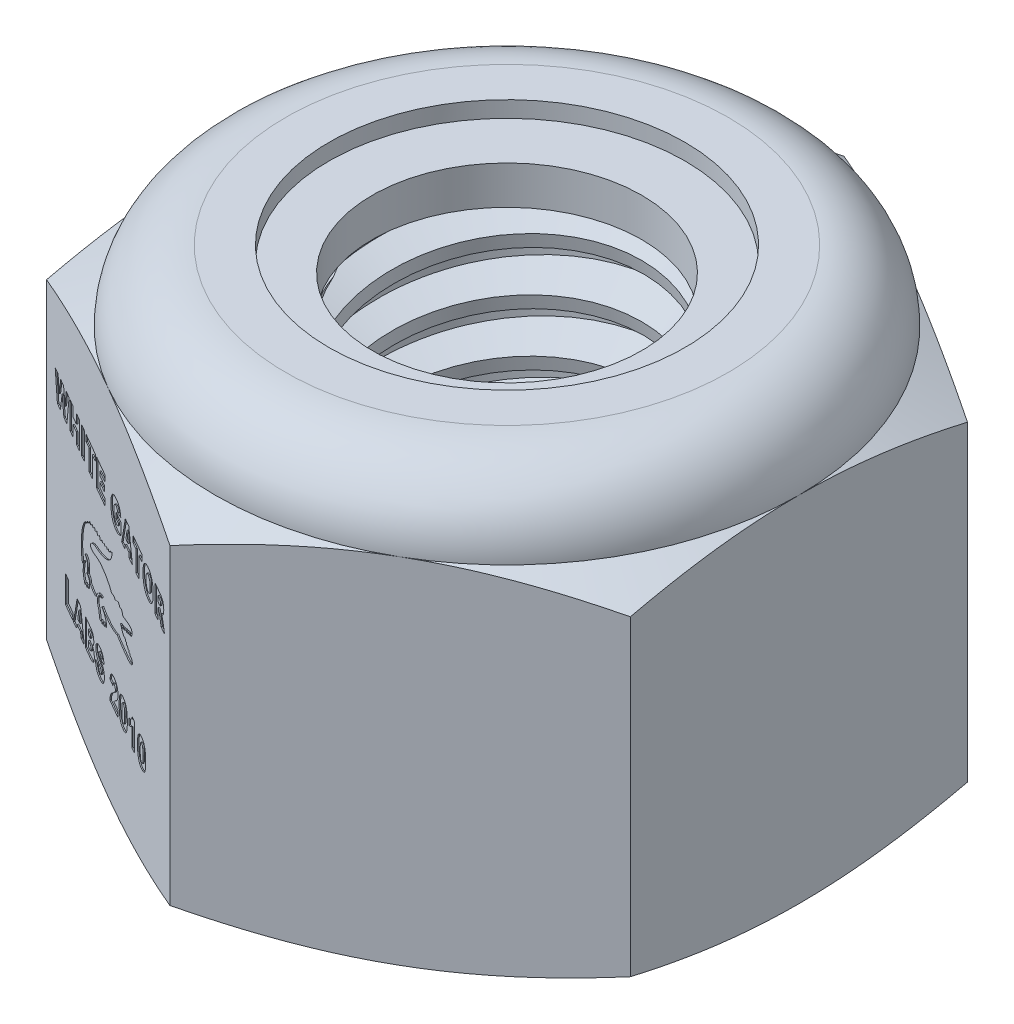
from build123d import *

# Parameters (mm, degrees)
EXTRUDE1_DEPTH       = 4
SKETCH2_W            = 1.5
SKETCH2_H            = 4
LPATTERN1_COUNT      = 8
LPATTERN1_PITCH      = 0.5
LPATTERN1_COUNT_DIR2 = 2
LPATTERN1_PITCH_DIR2 = 0.5
SKETCH8_W            = 0.078709247
SKETCH8_H            = 0.252525499
CUT_EXTRUDE1_DEPTH   = 0.01


with BuildPart() as part:
    # Sketch1 → Extrude1 (new body)
    with BuildSketch(Plane(origin=(0, 0, 0), x_dir=(1, 0, 0), z_dir=(0, 1, 0))):
        Polygon((0, 3.175426481), (-2.75, 1.58771324), (-2.75, -1.58771324), (0, -3.175426481), (2.75, -1.58771324), (2.75, 1.58771324), align=None)
    extrude(amount=EXTRUDE1_DEPTH)

    # Sketch4 → Cut-Revolve2 (revolve, cut)
    with BuildSketch(Plane(origin=(0, 0, 0), x_dir=(0, 0, -1), z_dir=(1, 0, 0))):
        Polygon((0, 4), (1.5, 4), (1.269011592, 3.892288336), (1.269011592, 0.107711664), (1.5, 0), (0, 0), align=None)
    revolve(axis=Axis((0, 4, 0), (0, 1, 0)), mode=Mode.SUBTRACT)


with BuildPart() as body_2:
    # Sketch2 → Revolve1 (revolve)
    with BuildSketch(Plane(origin=(0, 0, 0), x_dir=(0, 0, -1), z_dir=(1, 0, 0))):
        with Locations((0.75, 2)):
            Rectangle(SKETCH2_W, SKETCH2_H)
    revolve(axis=Axis((0, -1.5, 0), (0, 1, 0)))

    # Sketch3 → Cut-Revolve1 (revolve, cut)
    with BuildSketch(Plane(origin=(0, 0, 0), x_dir=(0, 0, -1), z_dir=(1, 0, 0))):
        Polygon((1.510274937, 3.93835038), (1.582199494, 3.506803038), (1.289561466, 3.616435308), (1.269011592, 3.739734548), align=None)
    cut_revolve1 = revolve(axis=Axis((0, 4, 0.089188249), (0, -0.9863939238321436, -0.1643989873053581)), mode=Mode.SUBTRACT)

    # LPattern1: Cut-Revolve1 8 × 2
    with Locations(*[Vector(0, -1, 0) * (i * LPATTERN1_PITCH) + Vector(0, 1, 0) * (j * LPATTERN1_PITCH_DIR2) for i in range(LPATTERN1_COUNT) for j in range(LPATTERN1_COUNT_DIR2) if (i, j) != (0, 0)]):
        add(cut_revolve1, mode=Mode.SUBTRACT)


with BuildPart() as part_1:
    add(part.part)

    # Combine1: cut body 2
    add(body_2.part, mode=Mode.SUBTRACT)

    # Sketch5 → Cut-Revolve3 (revolve, cut)
    with BuildSketch(Plane(origin=(0, 0, 0), x_dir=(0, 0, -1), z_dir=(1, 0, 0))):
        with BuildLine():
            Line((0, 0), (2.75, 0))
            Line((2.75, 0), (3.175426481, 0.198379626))
            Line((3.175426481, 0.198379626), (3.175426481, 3.134953707))
            Line((3.175426481, 3.134953707), (2.75, 3.333333333))
            ThreePointArc((2.75, 3.333333333), (2.554737854, 3.804737854), (2.083333333, 4))
            Line((2.083333333, 4), (2.083333333, 5.27))
            Line((2.083333333, 5.27), (4.445426481, 5.27))
            Line((4.445426481, 5.27), (4.445426481, -1.27))
            Line((4.445426481, -1.27), (0, -1.27))
            Line((0, -1.27), (0, 0))
        make_face()
    revolve(axis=Axis((0, 0, 0), (0, 1, 0)), mode=Mode.SUBTRACT)

    # Sketch6 → Cut-Revolve4 (revolve, cut)
    with BuildSketch(Plane(origin=(0, 0, 0), x_dir=(0, 0, -1), z_dir=(1, 0, 0))):
        with BuildLine():
            Line((0, 3.333333333), (2.5976, 3.333333333))
            ThreePointArc((2.5976, 3.333333333), (2.446974781, 3.696974781), (2.083333333, 3.8476))
            Line((2.083333333, 3.8476), (1.676172463, 3.8476))
            Line((1.676172463, 3.8476), (1.676172463, 5.27))
            Line((1.676172463, 5.27), (0, 5.27))
            Line((0, 5.27), (0, 3.333333333))
        make_face()
    revolve(axis=Axis((0, 5.27, 0), (0, 1, 0)), mode=Mode.SUBTRACT)

    # Sketch8 → Cut-Extrude1 (cut)
    # profile 1 of 19: a face of its own
    with BuildSketch(Plane(origin=(-1.375, 0, 2.38156986), x_dir=(0.8660254037844382, 0, 0.5000000000000007), z_dir=(-0.5000000000000008, 0, 0.8660254037844383))):
        with BuildLine():
            add(Edge.make_bspline(
                [(0.091261916, 2.061410439), (0.084945476, 2.043527403), (0.055580839, 2.047879277), (0.036897869, 2.027975428), (0.020924474, 2.008544355), (0.01126412, 2.019753288), (-0.000277331, 2.026239029), (-0.011115031, 2.01294942), (-0.022236495, 1.997366601), (-0.036751785, 2.008200113), (-0.053793417, 2.013051924), (-0.064358179, 1.997790234), (-0.078405687, 1.98510161), (-0.092175513, 1.992134721), (-0.103194612, 1.998773911), (-0.112209403, 1.990956719), (-0.121559685, 1.985479066), (-0.13181474, 1.979593407), (-0.140369213, 1.975381173), (-0.147162045, 1.975009815), (-0.15296125, 1.975802188), (-0.154668064, 1.980595621), (-0.156879787, 1.984598869), (-0.161961218, 1.984963723), (-0.167366775, 1.982778265), (-0.1715997, 1.975370202), (-0.179397318, 1.966534317), (-0.188919874, 1.959582369), (-0.197852058, 1.955909123), (-0.202862953, 1.955860691), (-0.207653459, 1.957427638), (-0.214858678, 1.959920121), (-0.217481206, 1.968540902), (-0.220061101, 1.976720536), (-0.226452121, 1.977389587), (-0.229739699, 1.973635062), (-0.235778247, 1.969361121), (-0.243570703, 1.961505335), (-0.253728867, 1.954567173), (-0.264295917, 1.949864318), (-0.274941559, 1.949125705), (-0.282277875, 1.955862663), (-0.284778504, 1.961812614), (-0.285675582, 1.967111536), (-0.28944807, 1.968126938), (-0.293696623, 1.968237929), (-0.296727372, 1.964458454), (-0.30716541, 1.955264309), (-0.318429323, 1.946761177), (-0.333523747, 1.940957398), (-0.340010302, 1.945272439), (-0.343938535, 1.951106795), (-0.348017157, 1.955872741), (-0.354305218, 1.958307422), (-0.359746393, 1.953717413), (-0.365923816, 1.946526279), (-0.373801464, 1.938365855), (-0.383429183, 1.932302186), (-0.391415904, 1.929927599), (-0.399174752, 1.931676134), (-0.403380873, 1.937167885), (-0.406840395, 1.944269642), (-0.412994848, 1.942227765), (-0.418004561, 1.941107045), (-0.421968518, 1.936612867), (-0.431533338, 1.926268362), (-0.440759947, 1.917176203), (-0.451794271, 1.91022796), (-0.454835045, 1.911703804), (-0.457721114, 1.914053039), (-0.460484198, 1.917596432), (-0.463597798, 1.921030462), (-0.466605893, 1.924823247), (-0.47181889, 1.926103848), (-0.476044759, 1.922821304), (-0.481768554, 1.916310402), (-0.490070423, 1.905766196), (-0.501805166, 1.893098218), (-0.513047829, 1.885203616), (-0.518275029, 1.878407121), (-0.522366778, 1.878399974), (-0.521785488, 1.881014099), (-0.523563096, 1.883316357), (-0.524144671, 1.888157051), (-0.532310581, 1.887247109), (-0.537579516, 1.882618581), (-0.545204585, 1.874665619), (-0.555358247, 1.864675278), (-0.565954116, 1.851056302), (-0.575278102, 1.84330879), (-0.578948696, 1.837193472), (-0.581954806, 1.837622861), (-0.58337989, 1.839878363), (-0.584903858, 1.84146548), (-0.586508663, 1.842817462), (-0.588763109, 1.84263594), (-0.592454627, 1.840637051), (-0.596755439, 1.834633908), (-0.610903139, 1.824907004), (-0.618985183, 1.812220564), (-0.626455987, 1.804465056)],
                knots=[0, 0, 0, 0, 0.048216964, 0.074016797, 0.097146327, 0.105851474, 0.117815555, 0.135225849, 0.154494981, 0.169728567, 0.186348302, 0.206896535, 0.224494547, 0.24212171, 0.253157166, 0.262095112, 0.277179678, 0.290164456, 0.300936228, 0.307748895, 0.312915849, 0.318200696, 0.32336765, 0.326572059, 0.333893275, 0.341325846, 0.35385996, 0.372719752, 0.379456636, 0.38534787, 0.388647011, 0.39614834, 0.408917819, 0.416224996, 0.422133634, 0.42567302, 0.432113802, 0.446565651, 0.461900012, 0.472180102, 0.484818768, 0.494044212, 0.502532058, 0.506728757, 0.509729664, 0.514353175, 0.519954194, 0.524425114, 0.560718987, 0.566270568, 0.575283028, 0.583005511, 0.589877136, 0.595845273, 0.602707975, 0.610898906, 0.627979605, 0.639327312, 0.648132297, 0.654752639, 0.663856415, 0.670956084, 0.676433509, 0.682355267, 0.68801786, 0.695367776, 0.72906036, 0.732220991, 0.735224284, 0.739168979, 0.744684113, 0.749827113, 0.754490251, 0.760478345, 0.764980145, 0.771212726, 0.789299007, 0.808977523, 0.827723076, 0.834537149, 0.836225223, 0.83845088, 0.841006564, 0.846040448, 0.851443182, 0.862598446, 0.869814475, 0.887479591, 0.909678498, 0.925708535, 0.928453283, 0.93126303, 0.933788563, 0.936971817, 0.938649938, 0.940356503, 0.943965021, 0.952207579, 0.964086486, 1, 1, 1, 1], degree=3))
            add(Edge.make_bspline(
                [(-0.626455987, 1.804465056), (-0.628878674, 1.799200376), (-0.636538086, 1.790693574), (-0.644975849, 1.775583548), (-0.654638694, 1.758866177), (-0.665433572, 1.738341746), (-0.673702507, 1.714670024), (-0.680398898, 1.69014147), (-0.686026696, 1.669413334), (-0.69040612, 1.649202628), (-0.693312721, 1.626474185), (-0.693855444, 1.595374098), (-0.694314339, 1.562436651), (-0.690972037, 1.529808849), (-0.683079116, 1.502229189), (-0.6731503, 1.479830538), (-0.66828713, 1.464814517), (-0.661923823, 1.459797502), (-0.657255026, 1.461812404), (-0.651386795, 1.462537477), (-0.643890197, 1.469388076), (-0.638124406, 1.479421575), (-0.633144823, 1.491081563), (-0.626763486, 1.498038754), (-0.622000952, 1.502303716), (-0.619622233, 1.50524704), (-0.616589574, 1.505277406), (-0.617038708, 1.501352167), (-0.620011916, 1.498684517), (-0.622397778, 1.492555862), (-0.626647915, 1.484881961), (-0.631353757, 1.47181109), (-0.636133753, 1.45678236), (-0.640197618, 1.441960119), (-0.641622622, 1.428978511), (-0.645029861, 1.418625248), (-0.644607744, 1.407940325), (-0.64513638, 1.397455442), (-0.64159306, 1.386406389), (-0.636713035, 1.376456588), (-0.631604877, 1.365771984), (-0.623939416, 1.355269443), (-0.614861255, 1.34480798), (-0.608393211, 1.333927981), (-0.600180357, 1.327727433), (-0.592295718, 1.326821969), (-0.587208806, 1.331154426), (-0.585596136, 1.336556957), (-0.585725495, 1.341329565), (-0.586022893, 1.344926265), (-0.584768162, 1.34813965), (-0.582592503, 1.350362715), (-0.579611679, 1.351607846), (-0.576200776, 1.351126577), (-0.571810942, 1.350664151), (-0.5691589, 1.346769453), (-0.563982638, 1.344900003), (-0.55980887, 1.340540298), (-0.553003485, 1.336530895), (-0.543537852, 1.333699282), (-0.538576643, 1.341105208), (-0.533443849, 1.345982312), (-0.532151733, 1.353583493), (-0.532076454, 1.360225087), (-0.531779121, 1.366600428), (-0.527831973, 1.369928084), (-0.523301348, 1.371947255), (-0.51896622, 1.368879625), (-0.513500675, 1.366016122), (-0.508887431, 1.361333577), (-0.502406039, 1.357451595), (-0.492823305, 1.360663421), (-0.486911605, 1.370621012), (-0.479298354, 1.38550231), (-0.481112383, 1.402185486), (-0.478684345, 1.417252925), (-0.482866374, 1.42651226), (-0.487822256, 1.433765857), (-0.494672114, 1.439755765), (-0.502604974, 1.442998885), (-0.51022818, 1.447436236), (-0.518363978, 1.449748672), (-0.530688731, 1.45156581), (-0.538020894, 1.451652365), (-0.546813117, 1.451058095), (-0.546252801, 1.454219893), (-0.543426507, 1.459379318), (-0.537710745, 1.46916143), (-0.532774524, 1.483218465), (-0.528749733, 1.498655719), (-0.527180496, 1.517233438), (-0.529828191, 1.534678341), (-0.539579033, 1.548947512), (-0.550101884, 1.558265264), (-0.560948966, 1.566308478), (-0.573046909, 1.570287184), (-0.583837469, 1.572534022), (-0.589844718, 1.573419733), (-0.593495123, 1.574642121), (-0.579604889, 1.578042538), (-0.573941528, 1.574625598), (-0.561041168, 1.576364157), (-0.554181347, 1.574235414), (-0.547471215, 1.571688797), (-0.540359539, 1.568085256), (-0.534449645, 1.56198757), (-0.527536952, 1.554855752), (-0.521888371, 1.545719844), (-0.51751727, 1.536410146), (-0.515157477, 1.527044321), (-0.512928961, 1.517208132), (-0.512990571, 1.505898762), (-0.513027813, 1.494096683), (-0.516078322, 1.481354961), (-0.516348152, 1.471478909), (-0.521404981, 1.463477745), (-0.518752663, 1.461178619), (-0.515374755, 1.460806479), (-0.509497272, 1.459476536), (-0.501313726, 1.459404341), (-0.493363747, 1.456554193), (-0.485838872, 1.455336945), (-0.472822918, 1.449269265), (-0.468587381, 1.436891654), (-0.466859154, 1.426422917), (-0.46470584, 1.426162151), (-0.458053139, 1.424644133), (-0.448983131, 1.421772282), (-0.438576795, 1.419555728), (-0.42808467, 1.417825487), (-0.416726539, 1.416354536), (-0.405017505, 1.41379069), (-0.395594039, 1.412839537), (-0.38565071, 1.413454875), (-0.373156493, 1.413634234), (-0.359746249, 1.413796055), (-0.346244043, 1.41354991), (-0.333864258, 1.412973581), (-0.321734508, 1.417734203), (-0.309431413, 1.422995892), (-0.296133982, 1.43610319), (-0.293984137, 1.450116793), (-0.28925332, 1.45772276)],
                knots=[0, 0, 0, 0, 0.011292471, 0.022299946, 0.033937002, 0.049308133, 0.067810405, 0.083097206, 0.099329487, 0.110042388, 0.123746725, 0.14430867, 0.171171957, 0.188483957, 0.208652631, 0.227111553, 0.23711153, 0.238855018, 0.242007422, 0.245967031, 0.25057812, 0.261004501, 0.268814533, 0.275270497, 0.279338097, 0.281420859, 0.282633912, 0.283841969, 0.28754428, 0.290724694, 0.296449337, 0.304901191, 0.3178933, 0.327543232, 0.335023517, 0.343551178, 0.348646619, 0.355939403, 0.364059678, 0.371053325, 0.377796758, 0.387292359, 0.396499635, 0.405032171, 0.41198881, 0.416064546, 0.419423934, 0.424192529, 0.426622174, 0.428837439, 0.431212885, 0.433133024, 0.434831613, 0.43733374, 0.439829736, 0.443123887, 0.445810067, 0.450441767, 0.454608575, 0.46190491, 0.465987075, 0.470747657, 0.475758024, 0.480319495, 0.48423235, 0.487455412, 0.490017263, 0.493235548, 0.496917513, 0.502389629, 0.506103485, 0.511015671, 0.520157141, 0.528135981, 0.543489078, 0.55207064, 0.5573519, 0.562929026, 0.569364614, 0.574846924, 0.579708043, 0.586635932, 0.591432736, 0.603610926, 0.604429179, 0.605144359, 0.608671362, 0.617239528, 0.626493636, 0.638192461, 0.6483949, 0.663163155, 0.671649054, 0.681816295, 0.690801194, 0.697820249, 0.706956357, 0.711272121, 0.711750836, 0.712906472, 0.72818428, 0.732900331, 0.736848915, 0.742241926, 0.74705295, 0.752346876, 0.758799277, 0.766575694, 0.773328212, 0.778940585, 0.785535919, 0.7930905, 0.801066332, 0.808798121, 0.818211375, 0.822203991, 0.823124689, 0.824553131, 0.828767853, 0.835042293, 0.840420613, 0.845231284, 0.850034933, 0.867854154, 0.868397769, 0.869422214, 0.871420983, 0.882676826, 0.887419492, 0.892446017, 0.903561426, 0.909938253, 0.916007869, 0.922109903, 0.929498632, 0.940595054, 0.948448249, 0.956154125, 0.964622924, 0.973681947, 0.982416276, 1, 1, 1, 1], degree=3))
            add(Edge.make_bspline(
                [(-0.28925332, 1.45772276), (-0.2871111, 1.460045643), (-0.283514449, 1.466111359), (-0.273472926, 1.475839577), (-0.26018416, 1.485494149), (-0.244481675, 1.49553797), (-0.226862359, 1.501228372), (-0.210859155, 1.50635307), (-0.198747076, 1.511298381), (-0.190087784, 1.511448389), (-0.183614069, 1.513456803), (-0.177105802, 1.514588658), (-0.172668001, 1.511221737), (-0.172434774, 1.506650539), (-0.175198022, 1.502546378), (-0.182636575, 1.501078055), (-0.191195142, 1.501761059), (-0.200945069, 1.498583344), (-0.208925395, 1.496924415), (-0.222680604, 1.492140899), (-0.238012987, 1.484582378), (-0.248152443, 1.472825859), (-0.255576669, 1.465635578), (-0.262581174, 1.456162732), (-0.268777924, 1.443117429), (-0.274448682, 1.430516051), (-0.273351203, 1.421149964), (-0.274405544, 1.41270847), (-0.273700629, 1.404023645), (-0.27480698, 1.393461072), (-0.26830349, 1.386913398), (-0.261727238, 1.380983882), (-0.255265296, 1.374136206), (-0.247547795, 1.366578291), (-0.240759825, 1.359078687), (-0.237603111, 1.351146234), (-0.23527346, 1.34344867), (-0.231529223, 1.334588868), (-0.226166497, 1.324417708), (-0.221482136, 1.313536107), (-0.217701458, 1.304468861), (-0.211098141, 1.301785), (-0.205998366, 1.302302659), (-0.199805906, 1.301366806), (-0.192639213, 1.305086426), (-0.185719783, 1.31086807), (-0.179919565, 1.317355764), (-0.178359724, 1.323345931), (-0.176142927, 1.326540333), (-0.17268554, 1.326747518), (-0.169686517, 1.322474916), (-0.166403595, 1.317513167), (-0.161481329, 1.31188464), (-0.157064843, 1.307296449), (-0.149442587, 1.306109579), (-0.143980882, 1.312609419), (-0.138414382, 1.318986487), (-0.135467382, 1.326647812), (-0.131353249, 1.332398154), (-0.131632057, 1.338403704), (-0.126793502, 1.340283776), (-0.124483684, 1.335487334), (-0.119663048, 1.332034505), (-0.113584523, 1.327686432), (-0.105496085, 1.323940575), (-0.093120324, 1.322925913), (-0.0851341, 1.334882539), (-0.083822944, 1.343742776), (-0.084069832, 1.34962178), (-0.082334153, 1.352702923), (-0.078517767, 1.356587203), (-0.072873697, 1.353008322), (-0.069662063, 1.348743152), (-0.064399408, 1.345975926), (-0.056861489, 1.342597419), (-0.047031221, 1.350158823), (-0.036159521, 1.372334247), (-0.054568237, 1.39516115), (-0.063684187, 1.403056843)],
                knots=[0, 0, 0, 0, 0.013276178, 0.029430013, 0.058362889, 0.082475503, 0.107406099, 0.135767828, 0.153617856, 0.161689362, 0.171706135, 0.182591217, 0.187314135, 0.193219481, 0.199941134, 0.206263784, 0.223752585, 0.236038349, 0.248873999, 0.258080175, 0.297357349, 0.318573554, 0.322951182, 0.34086593, 0.367575759, 0.384252202, 0.397411237, 0.406422835, 0.419883613, 0.434503825, 0.448292332, 0.45594766, 0.472232842, 0.487649979, 0.501620897, 0.514265952, 0.523127689, 0.535517016, 0.554693811, 0.571193172, 0.586428807, 0.593100844, 0.599506179, 0.607865188, 0.618812007, 0.631780822, 0.646414071, 0.653922814, 0.657826283, 0.661848474, 0.666146811, 0.678354609, 0.687637135, 0.697562095, 0.704452379, 0.717194003, 0.729381038, 0.740859679, 0.751175736, 0.758667171, 0.763451741, 0.767118387, 0.778224312, 0.788973136, 0.798201563, 0.81608951, 0.834980217, 0.851289468, 0.854120789, 0.85930277, 0.865993045, 0.873735327, 0.882605858, 0.889167539, 0.898502369, 0.91523045, 0.933533079, 1, 1, 1, 1], degree=3))
            add(Edge.make_bspline(
                [(-0.063684187, 1.403056843), (-0.070951002, 1.408735713), (-0.084697506, 1.417055919), (-0.105634808, 1.426169408), (-0.123612071, 1.43029105), (-0.139418554, 1.434637788), (-0.149995016, 1.436102617), (-0.157952355, 1.438189418), (-0.159412241, 1.444798448), (-0.152831598, 1.447480553), (-0.147172844, 1.445417766), (-0.137273723, 1.443925397), (-0.124496419, 1.440453314), (-0.106989913, 1.438704159), (-0.088779952, 1.43580508), (-0.062318362, 1.435090981), (-0.016964644, 1.435911341), (0.053833113, 1.435628278), (0.142686385, 1.453986405), (0.206646413, 1.467594075), (0.237338327, 1.484295092), (0.240799525, 1.483596422), (0.246046951, 1.480324293), (0.255549069, 1.474462983), (0.267219548, 1.476924519), (0.278566324, 1.472479959), (0.289899614, 1.47383219), (0.306346138, 1.473665218), (0.324156153, 1.47162468), (0.345196492, 1.471697968), (0.363088341, 1.47198949), (0.382867216, 1.469364491), (0.406170555, 1.470379597), (0.444734723, 1.469783201), (0.482544798, 1.470467906), (0.517085038, 1.469597652), (0.548352889, 1.473067469), (0.572937052, 1.475877791), (0.589074293, 1.482133345)],
                knots=[0, 0, 0, 0, 0.031947682, 0.055620488, 0.078812347, 0.095960836, 0.112075546, 0.116761877, 0.123004295, 0.129425947, 0.136592297, 0.143897009, 0.164037534, 0.182449568, 0.20482689, 0.227974837, 0.274131209, 0.362396203, 0.472777382, 0.587782208, 0.589110406, 0.591036727, 0.599391077, 0.61084794, 0.628309445, 0.637774367, 0.652280259, 0.66699046, 0.695046005, 0.714252076, 0.73999817, 0.757023687, 0.783308651, 0.820705619, 0.890915412, 0.914559947, 0.94042783, 1, 1, 1, 1], degree=3))
            add(Edge.make_bspline(
                [(0.589074293, 1.482133345), (0.598304609, 1.484548701), (0.609216821, 1.491283632), (0.620752075, 1.503304388), (0.620631317, 1.511135441), (0.62101562, 1.516736751), (0.617820606, 1.523300193), (0.612268733, 1.530325993), (0.603147822, 1.53669633), (0.592647721, 1.539285693), (0.58232268, 1.539298603), (0.575433383, 1.537773777), (0.572990256, 1.531225273), (0.571506578, 1.532629662), (0.569596836, 1.531624258), (0.569364729, 1.534562304), (0.567332647, 1.535928908), (0.566226915, 1.539286758), (0.563916393, 1.5429922), (0.561580414, 1.546931151), (0.558748044, 1.549649326), (0.555972197, 1.549793619), (0.553636365, 1.549438996), (0.551659808, 1.547952268), (0.54997217, 1.545897736), (0.547088261, 1.545381846), (0.545475462, 1.542770649), (0.54248881, 1.543025991), (0.539346633, 1.542015475), (0.53778645, 1.545413408), (0.535976761, 1.547765884), (0.534345081, 1.550285313), (0.532821638, 1.552747401), (0.531209739, 1.554935499), (0.530059539, 1.55837435), (0.526025998, 1.557230681), (0.523071185, 1.557922519), (0.519555103, 1.556947547), (0.516376058, 1.555251858), (0.512905859, 1.552627424), (0.510006937, 1.553208031), (0.507827976, 1.55280408), (0.506647576, 1.555145281), (0.505345025, 1.557916643), (0.502832817, 1.562310523), (0.499842588, 1.566729934), (0.496270904, 1.573351116), (0.488453346, 1.568738771), (0.485003865, 1.566027885), (0.480970735, 1.563418235)],
                knots=[0, 0, 0, 0, 0.116546071, 0.171978945, 0.193508718, 0.214321362, 0.242768959, 0.283280105, 0.328295166, 0.381564296, 0.418486365, 0.458732166, 0.472204911, 0.475170927, 0.481196785, 0.492391505, 0.499561578, 0.512517907, 0.535049779, 0.555737592, 0.571405939, 0.581908311, 0.589881076, 0.601112492, 0.61253128, 0.622685485, 0.636539895, 0.645930541, 0.659361927, 0.672182485, 0.686144983, 0.699009795, 0.71007957, 0.722752973, 0.735213602, 0.748490634, 0.766903163, 0.77485258, 0.79395513, 0.813798817, 0.825742079, 0.830967256, 0.839633125, 0.853704709, 0.872929063, 0.901651107, 0.928936126, 0.946032292, 1, 1, 1, 1], degree=3))
            add(Edge.make_bspline(
                [(0.480970735, 1.563418235), (0.479493353, 1.563302698), (0.477146185, 1.561683493), (0.473918571, 1.563486517), (0.472721206, 1.566225824), (0.470077824, 1.571370782), (0.468340416, 1.576830324), (0.464485116, 1.58105011), (0.461476214, 1.58112495), (0.458815405, 1.579568308), (0.455484136, 1.577634785), (0.451716821, 1.575484408), (0.448438712, 1.573830581), (0.444839676, 1.573259963), (0.442626928, 1.576497149), (0.440481837, 1.58143282), (0.4381746, 1.586603915), (0.43616303, 1.591536438), (0.432880092, 1.593967403), (0.430270163, 1.592302369), (0.42743738, 1.590869843), (0.422570537, 1.587855037), (0.413581435, 1.585331146), (0.402440354, 1.585258865), (0.392046554, 1.585200091), (0.381972328, 1.588040884), (0.372443571, 1.593762186), (0.359976904, 1.601120388), (0.348313259, 1.608547769), (0.332364991, 1.618492788), (0.32608987, 1.622062346), (0.315362506, 1.630085165), (0.316974915, 1.629873979), (0.318610773, 1.629963634), (0.327385513, 1.629968075), (0.339730465, 1.627147741), (0.346989617, 1.63576342), (0.351757378, 1.637426071), (0.354812431, 1.63577746), (0.357205907, 1.633180333), (0.360455097, 1.630969889), (0.36328119, 1.628347688), (0.365988369, 1.625815159), (0.36958506, 1.625079601), (0.373158119, 1.626514125), (0.377257881, 1.630141519), (0.380993282, 1.638343618), (0.384560989, 1.644697993), (0.388249578, 1.651334878), (0.392085815, 1.649585501), (0.395519116, 1.645405895), (0.400898861, 1.64177381), (0.406713493, 1.638860985), (0.411505517, 1.64107615), (0.413197529, 1.646027943), (0.415304946, 1.651141918), (0.416017407, 1.656584211), (0.416917674, 1.661214071), (0.42007196, 1.664668939), (0.425060897, 1.664218785), (0.429624341, 1.661321534), (0.434019213, 1.657348102), (0.438524874, 1.654652962), (0.442731084, 1.650971417), (0.448559179, 1.655838936), (0.448069376, 1.660943306), (0.449313677, 1.664207471)],
                knots=[0, 0, 0, 0, 0.012279565, 0.017915052, 0.02627493, 0.034934062, 0.063098495, 0.070685493, 0.076795485, 0.084706328, 0.09430205, 0.106898031, 0.118255382, 0.123208516, 0.133348035, 0.143982626, 0.16697784, 0.176089533, 0.186449054, 0.192438747, 0.198312126, 0.211604089, 0.236513557, 0.26967831, 0.298060255, 0.316841929, 0.350190941, 0.384056578, 0.429000283, 0.460132727, 0.521155486, 0.524459791, 0.526803918, 0.529734078, 0.538915243, 0.59276395, 0.614565596, 0.62143604, 0.629926201, 0.639335212, 0.649220851, 0.660154879, 0.669492647, 0.677461148, 0.687159734, 0.698241092, 0.719487972, 0.754518686, 0.762314447, 0.769011535, 0.781856569, 0.805945372, 0.819100832, 0.829390607, 0.842334276, 0.858062279, 0.872693837, 0.884767394, 0.894388945, 0.905805497, 0.919872007, 0.936456105, 0.950946567, 0.962907166, 0.972927188, 1, 1, 1, 1], degree=3))
            add(Edge.make_bspline(
                [(0.449313677, 1.664207471), (0.450644109, 1.668310276), (0.450447648, 1.675500327), (0.457612692, 1.679546679), (0.462401011, 1.677805045), (0.466858409, 1.674005198), (0.471504841, 1.670609476), (0.477272768, 1.665281416), (0.483855071, 1.673684455), (0.485052371, 1.682039651), (0.488693093, 1.689312786), (0.493511707, 1.694266916), (0.497451534, 1.690292193), (0.502378846, 1.688542678), (0.506188675, 1.684284827), (0.511592508, 1.681108774), (0.518710894, 1.683518621), (0.519788231, 1.690744335), (0.523076301, 1.697766282), (0.526260118, 1.703053311), (0.530666986, 1.708043448), (0.535631284, 1.706316028), (0.538854071, 1.702206875), (0.54268806, 1.697955253), (0.549520405, 1.69301477), (0.557697966, 1.7024427), (0.560083681, 1.710856128), (0.564746593, 1.717642308), (0.569382967, 1.718121037), (0.57157202, 1.714841517), (0.575461138, 1.71237407), (0.578618767, 1.708264516), (0.582340236, 1.704483228), (0.587913916, 1.705063898), (0.592429748, 1.711667746), (0.593516673, 1.71914083), (0.594816922, 1.726388429), (0.60007647, 1.730002329), (0.607563656, 1.732473757), (0.616159371, 1.742021057), (0.615558798, 1.756085623), (0.607807068, 1.765648621), (0.598581413, 1.771313423), (0.588410218, 1.774885375), (0.578935122, 1.774353255), (0.569800818, 1.774494761), (0.561526203, 1.774484704), (0.552061282, 1.773911238), (0.543609562, 1.771834484), (0.53454751, 1.770080907), (0.525770521, 1.767520991), (0.516111171, 1.765691744), (0.50637562, 1.76429193), (0.49725589, 1.761283762), (0.48605128, 1.759065792), (0.477932228, 1.756184568), (0.472346466, 1.755102681)],
                knots=[0, 0, 0, 0, 0.032452064, 0.043004835, 0.053245941, 0.066769083, 0.084815251, 0.098003839, 0.112840312, 0.145120866, 0.162081124, 0.173876907, 0.18503046, 0.195112401, 0.212342685, 0.225207224, 0.23791445, 0.259139212, 0.272300465, 0.294080065, 0.305739868, 0.314199341, 0.327606525, 0.342984262, 0.357157547, 0.38004449, 0.41242784, 0.428075336, 0.433326608, 0.443080605, 0.453194905, 0.46673733, 0.480816063, 0.487976366, 0.504123157, 0.532442624, 0.544591911, 0.554196226, 0.576223135, 0.601695493, 0.640748728, 0.665285102, 0.688091844, 0.718331267, 0.741128082, 0.75591888, 0.784292613, 0.800791796, 0.824130423, 0.846862845, 0.86736577, 0.889975066, 0.917733063, 0.938104972, 0.959047903, 1, 1, 1, 1], degree=3))
            add(Edge.make_bspline(
                [(0.472346466, 1.755102681), (0.466661114, 1.754134546), (0.457858387, 1.751663165), (0.446049232, 1.749056904), (0.436928839, 1.747268668), (0.427738535, 1.745201486), (0.418185902, 1.742770559), (0.408441469, 1.740750946), (0.399354219, 1.738912178), (0.391065071, 1.736158366), (0.38361001, 1.734404196), (0.378552255, 1.732141388), (0.37479186, 1.73227866), (0.373388121, 1.734365089), (0.37128035, 1.737840198), (0.368833617, 1.74248231), (0.362926168, 1.748024775), (0.355819323, 1.753797027), (0.347653022, 1.759861421), (0.337296906, 1.760198001), (0.328664381, 1.760880612), (0.318867582, 1.75700314), (0.312955114, 1.751544352), (0.304437788, 1.749738672), (0.297096848, 1.749321689), (0.290111597, 1.753533135), (0.28577221, 1.757477105), (0.277529865, 1.762851644), (0.261390696, 1.766484918), (0.242065042, 1.761771365), (0.227126511, 1.75336965), (0.215455122, 1.746536802), (0.203610037, 1.740096364), (0.192313736, 1.735493132), (0.184212919, 1.730020956), (0.17370957, 1.730320661), (0.164382095, 1.735639525), (0.14922718, 1.735440168), (0.139491147, 1.736157612), (0.132932424, 1.735615965)],
                knots=[0, 0, 0, 0, 0.047002016, 0.074580583, 0.098698164, 0.122867516, 0.151467764, 0.179139021, 0.204124939, 0.227030057, 0.250434853, 0.266286497, 0.272441733, 0.278680534, 0.285281638, 0.306306361, 0.320614767, 0.350898754, 0.382219686, 0.399602264, 0.434254654, 0.451623351, 0.484206387, 0.497343853, 0.522159153, 0.541773663, 0.561792769, 0.570227473, 0.621862165, 0.690650076, 0.727533694, 0.761682827, 0.801147075, 0.837190087, 0.86192917, 0.878108141, 0.919975542, 0.946367323, 1, 1, 1, 1], degree=3))
            add(Edge.make_bspline(
                [(0.132932424, 1.735615965), (0.128976668, 1.735802833), (0.121669357, 1.731469336), (0.109439855, 1.725809572), (0.094077983, 1.725025258), (0.077839762, 1.724612458), (0.061634753, 1.734568564), (0.049334161, 1.738224145), (0.04157036, 1.740917392)],
                knots=[0, 0, 0, 0, 0.122508249, 0.251504586, 0.420804394, 0.597875196, 0.744140471, 1, 1, 1, 1], degree=3))
            add(Edge.make_bspline(
                [(0.04157036, 1.740917392), (0.028633659, 1.746047147), (0.011696675, 1.747558052), (-0.007678134, 1.753851279), (-0.017393854, 1.756298882), (-0.028043926, 1.757676571), (-0.039123671, 1.759807836), (-0.051039598, 1.762044517), (-0.068909775, 1.764670471), (-0.093337412, 1.765747648), (-0.129843486, 1.768791394), (-0.167103194, 1.7667419), (-0.198454063, 1.769115489), (-0.219921468, 1.765240816), (-0.237332422, 1.764016181), (-0.25708078, 1.76167195), (-0.274326579, 1.757730807), (-0.288567158, 1.753743347), (-0.301147319, 1.750989304), (-0.314838657, 1.746759351), (-0.334069639, 1.742606963), (-0.357273267, 1.735870731), (-0.377922922, 1.732340122), (-0.402424695, 1.728115246), (-0.4220965, 1.72799093), (-0.442599424, 1.726390291), (-0.452193331, 1.73127514), (-0.458603558, 1.737896587), (-0.45945692, 1.74699158), (-0.453305266, 1.755486087), (-0.44021478, 1.768667015), (-0.420978821, 1.783390243), (-0.396953452, 1.793872662), (-0.376962865, 1.804789443), (-0.357602234, 1.810377432), (-0.339300154, 1.816483824), (-0.31873348, 1.820598325), (-0.295004321, 1.826375588), (-0.268415517, 1.831565028), (-0.244073567, 1.838157745), (-0.217787722, 1.846253207), (-0.18908892, 1.853085416), (-0.160155151, 1.86263772), (-0.132284376, 1.871837242), (-0.093585793, 1.886641437), (-0.046963797, 1.905675006), (0.003431442, 1.933097593), (0.046591071, 1.962040009), (0.076808303, 1.995754688), (0.092962641, 2.029764567), (0.097951356, 2.052088998), (0.091261916, 2.061410439)],
                knots=[0, 0, 0, 0, 0.034896265, 0.042334571, 0.051392618, 0.060136789, 0.069415094, 0.079868894, 0.090742842, 0.114971131, 0.141540014, 0.183100139, 0.209109245, 0.220294865, 0.237991348, 0.253160385, 0.270440165, 0.28257517, 0.290489217, 0.30293106, 0.318710993, 0.340125825, 0.363845044, 0.371563876, 0.402788182, 0.413927278, 0.42222723, 0.42911126, 0.436434221, 0.442974809, 0.454752885, 0.483685683, 0.503112761, 0.520858935, 0.540980384, 0.553762703, 0.569548987, 0.593836618, 0.615430556, 0.637896306, 0.657454294, 0.684851583, 0.712299562, 0.734326224, 0.758931993, 0.816879492, 0.861279783, 0.903493722, 0.947904783, 0.972512297, 1, 1, 1, 1], degree=3))
        make_face()
    # profile 2 of 19: a face of its own
    with BuildSketch(Plane(origin=(-1.375, 0, 2.38156986), x_dir=(0.8660254037844382, 0, 0.5000000000000007), z_dir=(-0.5000000000000008, 0, 0.8660254037844383))):
        Polygon((-1.365035624, 2.569386715), (-1.290579546, 2.569386715), (-1.26244714, 2.429237112), (-1.223195003, 2.569386715), (-1.14950757, 2.569386715), (-1.109794246, 2.428417224), (-1.081661839, 2.569386715), (-1.007564463, 2.569386715), (-1.063931762, 2.316861216), (-1.141462419, 2.316861216), (-1.186300043, 2.475868242), (-1.230881452, 2.316861216), (-1.308258381, 2.316861216), align=None)
    # profile 3 of 19: a face of its own
    with BuildSketch(Plane(origin=(-1.375, 0, 2.38156986), x_dir=(0.8660254037844382, 0, 0.5000000000000007), z_dir=(-0.5000000000000008, 0, 0.8660254037844383))):
        Polygon((-0.984607599, 2.569386715), (-0.905898353, 2.569386715), (-0.905898353, 2.480838812), (-0.820630002, 2.480838812), (-0.820630002, 2.569386715), (-0.741920756, 2.569386715), (-0.741920756, 2.316861216), (-0.820630002, 2.316861216), (-0.820630002, 2.418527326), (-0.905898353, 2.418527326), (-0.905898353, 2.316861216), (-0.984607599, 2.316861216), align=None)
    # profile 4 of 19: a face of its own
    with BuildSketch(Plane(origin=(-1.375, 0, 2.38156986), x_dir=(0.8660254037844382, 0, 0.5000000000000007), z_dir=(-0.5000000000000008, 0, 0.8660254037844383))):
        with Locations((-0.64681375, 2.443123965)):
            Rectangle(SKETCH8_W, SKETCH8_H)
    # profile 5 of 19: a face of its own
    with BuildSketch(Plane(origin=(-1.375, 0, 2.38156986), x_dir=(0.8660254037844382, 0, 0.5000000000000007), z_dir=(-0.5000000000000008, 0, 0.8660254037844383))):
        Polygon((-0.568104503, 2.569386715), (-0.331976764, 2.569386715), (-0.331976764, 2.51035478), (-0.41068601, 2.51035478), (-0.41068601, 2.316861216), (-0.489395257, 2.316861216), (-0.489395257, 2.51035478), (-0.568104503, 2.51035478), align=None)
    # profile 6 of 19: a face of its own
    with BuildSketch(Plane(origin=(-1.375, 0, 2.38156986), x_dir=(0.8660254037844382, 0, 0.5000000000000007), z_dir=(-0.5000000000000008, 0, 0.8660254037844383))):
        Polygon((-0.295901692, 2.569386715), (-0.086010369, 2.569386715), (-0.086010369, 2.51035478), (-0.217192446, 2.51035478), (-0.217192446, 2.474279709), (-0.095849024, 2.474279709), (-0.095849024, 2.421806878), (-0.217192446, 2.421806878), (-0.217192446, 2.375893151), (-0.082730817, 2.375893151), (-0.082730817, 2.316861216), (-0.295901692, 2.316861216), align=None)
    # profile 7 of 19: a face of its own
    with BuildSketch(Plane(origin=(-1.375, 0, 2.38156986), x_dir=(0.8660254037844382, 0, 0.5000000000000007), z_dir=(-0.5000000000000008, 0, 0.8660254037844383))):
        with BuildLine():
            Line((0.205869754, 2.40868867), (0.205869754, 2.461161501))
            Line((0.205869754, 2.461161501), (0.327213176, 2.461161501))
            Line((0.327213176, 2.461161501), (0.327213176, 2.356984484))
            add(Edge.make_bspline(
                [(0.327213176, 2.356984484), (0.32435569, 2.354951302), (0.318776664, 2.350981668), (0.310399349, 2.345460784), (0.302344326, 2.340375473), (0.294496845, 2.335832134), (0.28690644, 2.331799795), (0.279550945, 2.328256592), (0.272500162, 2.325145728), (0.265564566, 2.322593868), (0.258591309, 2.320479581), (0.251409687, 2.318637571), (0.243925733, 2.317041545), (0.236127628, 2.315763905), (0.228020652, 2.314811953), (0.219597128, 2.314078342), (0.210861223, 2.313682709), (0.204930651, 2.313615657), (0.201924043, 2.313581664)],
                knots=[0, 0, 0, 0, 1.243536589, 2.427911695, 3.557294573, 4.621152388, 5.64268009, 6.60441749, 7.515896466, 8.37443551, 9.223239969, 10.098831722, 11.002894179, 11.935954671, 12.899883145, 13.896872717, 14.933782436, 16, 16, 16, 16], degree=3))
            add(Edge.make_bspline(
                [(0.201924043, 2.313581664), (0.198233372, 2.313632576), (0.19101572, 2.313732143), (0.180463764, 2.314457642), (0.170441032, 2.315628583), (0.160936185, 2.317242766), (0.151954053, 2.319401643), (0.143478903, 2.32201221), (0.1355079, 2.325057928), (0.12808976, 2.328681084), (0.121129599, 2.332758655), (0.114560803, 2.337267068), (0.108388101, 2.342230765), (0.102687272, 2.347734615), (0.097285821, 2.353590974), (0.092361325, 2.359987847), (0.087849174, 2.366835408), (0.083707145, 2.374084698), (0.080019288, 2.381717753), (0.076832824, 2.389679296), (0.074196505, 2.39792789), (0.071975199, 2.406426833), (0.070225443, 2.415201718), (0.069009418, 2.424272632), (0.068285017, 2.433615058), (0.068181145, 2.439928541), (0.068128573, 2.443123965)],
                knots=[0, 0, 0, 0, 1.253917797, 2.452221344, 3.591772203, 4.681385492, 5.725859798, 6.728156954, 7.692763343, 8.621995269, 9.52977499, 10.431262374, 11.326770578, 12.217527041, 13.121290676, 14.03140493, 14.956950458, 15.905713694, 16.866120798, 17.834977804, 18.81688793, 19.806469012, 20.818314857, 21.854955819, 22.914335131, 24, 24, 24, 24], degree=3))
            add(Edge.make_bspline(
                [(0.068128573, 2.443123965), (0.068170743, 2.44649086), (0.068253716, 2.453115457), (0.069119234, 2.462881698), (0.070411194, 2.472318458), (0.072331899, 2.481417238), (0.074726683, 2.490184959), (0.077653585, 2.498632377), (0.081131368, 2.506741482), (0.085199762, 2.514486228), (0.089730378, 2.521849367), (0.094790086, 2.528782382), (0.100380082, 2.535224374), (0.106444854, 2.541234842), (0.112980943, 2.546820517), (0.120072887, 2.551860456), (0.127619108, 2.556529102), (0.132962321, 2.55917993), (0.135666845, 2.560521676)],
                knots=[0, 0, 0, 0, 1.125501259, 2.214501484, 3.275832334, 4.308594968, 5.321456896, 6.313082122, 7.295503325, 8.268817801, 9.235659301, 10.183814714, 11.135352819, 12.084419482, 13.036574446, 14.006582172, 14.991010129, 16, 16, 16, 16], degree=3))
            add(Edge.make_bspline(
                [(0.135666845, 2.560521676), (0.137907408, 2.56151342), (0.142490192, 2.563541905), (0.149832746, 2.565989265), (0.15772552, 2.567987328), (0.166161087, 2.569767473), (0.175164911, 2.57107037), (0.18472567, 2.571972128), (0.194828471, 2.572545894), (0.20175244, 2.572625441), (0.205306081, 2.572666267)],
                knots=[0, 0, 0, 0, 0.82525077, 1.687944398, 2.603683853, 3.567637826, 4.591578893, 5.667081581, 6.802658573, 8, 8, 8, 8], degree=3))
            add(Edge.make_bspline(
                [(0.205306081, 2.572666267), (0.208722651, 2.572652301), (0.215318722, 2.572625339), (0.224888108, 2.572258361), (0.233777489, 2.57166948), (0.242011696, 2.570779682), (0.249577333, 2.569746813), (0.256486058, 2.568405488), (0.262729786, 2.566860866), (0.270079753, 2.564384346), (0.278492974, 2.560731518), (0.287703881, 2.555194621), (0.296026468, 2.548598246), (0.303412335, 2.540873267), (0.309896369, 2.532070019), (0.315552908, 2.522206879), (0.320348675, 2.511241729), (0.322716184, 2.50341401), (0.323933624, 2.499388778)],
                knots=[0, 0, 0, 0, 1.069735428, 2.065243883, 2.998077686, 3.858639969, 4.658133307, 5.388186337, 6.061427702, 6.67030134, 7.815060945, 8.925844656, 10.025915159, 11.130462127, 12.262203824, 13.441052052, 14.684117286, 16, 16, 16, 16], degree=3))
            Line((0.323933624, 2.499388778), (0.245224377, 2.487397916))
            add(Edge.make_bspline(
                [(0.245224377, 2.487397916), (0.24440411, 2.489430088), (0.242793131, 2.493421213), (0.239249626, 2.498744462), (0.234908993, 2.503299838), (0.229768146, 2.507061699), (0.223874831, 2.51006131), (0.21720506, 2.5121335), (0.209815527, 2.513442046), (0.204628815, 2.513568427), (0.201924043, 2.513634332)],
                knots=[0, 0, 0, 0, 0.965951035, 1.897098818, 2.804250694, 3.732245097, 4.697223386, 5.711239545, 6.806454538, 8, 8, 8, 8], degree=3))
            add(Edge.make_bspline(
                [(0.201924043, 2.513634332), (0.199872028, 2.513586835), (0.195872439, 2.513494259), (0.190029984, 2.512722872), (0.184521909, 2.511381998), (0.179313598, 2.509536154), (0.174416378, 2.507164506), (0.169833579, 2.504291772), (0.16558844, 2.500866681), (0.161696038, 2.496919636), (0.158154926, 2.492402356), (0.155093251, 2.487272959), (0.152530037, 2.481519767), (0.150437294, 2.475182538), (0.148815719, 2.468235571), (0.147641633, 2.460700262), (0.146999465, 2.45254672), (0.14689305, 2.446917027), (0.146837819, 2.443995096)],
                knots=[0, 0, 0, 0, 0.97489115, 1.900163636, 2.793961043, 3.664304128, 4.521066341, 5.37459257, 6.229006061, 7.107186837, 8.003487059, 8.950089612, 9.938271684, 10.990674675, 12.116840394, 13.324563593, 14.611391239, 16, 16, 16, 16], degree=3))
            add(Edge.make_bspline(
                [(0.146837819, 2.443995096), (0.146888218, 2.44090212), (0.146985262, 2.434946484), (0.147689128, 2.426349681), (0.148913751, 2.418439072), (0.150580221, 2.411200344), (0.152718013, 2.404629346), (0.155381754, 2.3987397), (0.158554796, 2.39353042), (0.162237482, 2.38900466), (0.166385794, 2.385151609), (0.170883454, 2.381808515), (0.175722814, 2.378875601), (0.181020717, 2.376618769), (0.186659878, 2.374793076), (0.1926723, 2.373538205), (0.199067518, 2.372748505), (0.2034589, 2.372659398), (0.205716025, 2.372613599)],
                knots=[0, 0, 0, 0, 1.399302637, 2.694406651, 3.898885205, 5.01797942, 6.051713933, 7.020030275, 7.935888621, 8.803699277, 9.651141264, 10.49040411, 11.335976491, 12.204612586, 13.089325806, 14.013913145, 14.979171687, 16, 16, 16, 16], degree=3))
            add(Edge.make_bspline(
                [(0.205716025, 2.372613599), (0.207887374, 2.372646701), (0.21220634, 2.372712545), (0.218584747, 2.373431248), (0.224828044, 2.374416533), (0.23099066, 2.375948384), (0.237291894, 2.378009014), (0.243954717, 2.380569749), (0.251045019, 2.383769789), (0.255842787, 2.386238849), (0.258342585, 2.387525311)],
                knots=[0, 0, 0, 0, 0.941933758, 1.873572208, 2.782730895, 3.683509501, 4.625939037, 5.658467904, 6.779983351, 8, 8, 8, 8], degree=3))
            Line((0.258342585, 2.387525311), (0.258342585, 2.40868867))
            Line((0.258342585, 2.40868867), (0.205869754, 2.40868867))
        make_face()
    # profile 8 of 19: a face of its own
    with BuildSketch(Plane(origin=(-1.375, 0, 2.38156986), x_dir=(0.8660254037844382, 0, 0.5000000000000007), z_dir=(-0.5000000000000008, 0, 0.8660254037844383))):
        Polygon((0.527522059, 2.359495391), (0.439589072, 2.359495391), (0.426829566, 2.316861216), (0.346890487, 2.316861216), (0.439435343, 2.569386715), (0.528239461, 2.569386715), (0.62237285, 2.316861216), (0.540281565, 2.316861216), align=None)
        Polygon((0.510816841, 2.415247774), (0.482991893, 2.504820536), (0.456243047, 2.415247774), align=None, mode=Mode.SUBTRACT)
    # profile 9 of 19: a face of its own
    with BuildSketch(Plane(origin=(-1.375, 0, 2.38156986), x_dir=(0.8660254037844382, 0, 0.5000000000000007), z_dir=(-0.5000000000000008, 0, 0.8660254037844383))):
        Polygon((0.632211506, 2.569386715), (0.868339245, 2.569386715), (0.868339245, 2.51035478), (0.789629999, 2.51035478), (0.789629999, 2.316861216), (0.710920752, 2.316861216), (0.710920752, 2.51035478), (0.632211506, 2.51035478), align=None)
    # profile 10 of 19: a face of its own
    with BuildSketch(Plane(origin=(-1.375, 0, 2.38156986), x_dir=(0.8660254037844382, 0, 0.5000000000000007), z_dir=(-0.5000000000000008, 0, 0.8660254037844383))):
        with BuildLine():
            add(Edge.make_bspline(
                [(0.894575661, 2.442970236), (0.894687384, 2.447944917), (0.8949049, 2.457630181), (0.89649197, 2.471746427), (0.899198461, 2.485023007), (0.902980005, 2.497450751), (0.907802891, 2.509052666), (0.913789204, 2.519766252), (0.92083344, 2.529664033), (0.928951428, 2.538656954), (0.938056331, 2.546645528), (0.94798165, 2.553690069), (0.958850284, 2.559530719), (0.970522515, 2.564359646), (0.983042297, 2.568100076), (0.996393204, 2.570720868), (1.010580049, 2.572422306), (1.020337937, 2.572583505), (1.025347794, 2.572666267)],
                knots=[0, 0, 0, 0, 1.141509498, 2.222418089, 3.254874486, 4.246852721, 5.199093221, 6.132658289, 7.057234514, 7.981445045, 8.906287139, 9.831793572, 10.768447856, 11.731542758, 12.726135355, 13.761653047, 14.850796617, 16, 16, 16, 16], degree=3))
            add(Edge.make_bspline(
                [(1.025347794, 2.572666267), (1.03045957, 2.572578396), (1.040418817, 2.572407199), (1.054896524, 2.570776849), (1.068504256, 2.568208147), (1.081189374, 2.564526508), (1.092983879, 2.559802508), (1.103844566, 2.55399358), (1.113829781, 2.547135218), (1.122848351, 2.539217048), (1.130926374, 2.530408021), (1.137890777, 2.520668332), (1.143804915, 2.510118728), (1.148639805, 2.498707483), (1.152373929, 2.486457542), (1.154990503, 2.473377886), (1.156697088, 2.459481362), (1.156857445, 2.44992749), (1.156939816, 2.445019956)],
                knots=[0, 0, 0, 0, 1.176285812, 2.291751944, 3.348956565, 4.360547542, 5.327243456, 6.268348987, 7.189933859, 8.109453091, 9.025105683, 9.935135631, 10.859333698, 11.803612512, 12.782426517, 13.801834825, 14.870869136, 16, 16, 16, 16], degree=3))
            add(Edge.make_bspline(
                [(1.156939816, 2.445019956), (1.156882633, 2.441449218), (1.156770632, 2.434455275), (1.156129635, 2.424206108), (1.154939775, 2.414441438), (1.153319514, 2.405164495), (1.151220667, 2.396383546), (1.148672798, 2.38808314), (1.145583275, 2.380307261), (1.142107765, 2.372975792), (1.138115102, 2.366138226), (1.13377517, 2.359664958), (1.128978151, 2.353599216), (1.123804484, 2.347900584), (1.118202007, 2.342586092), (1.11212617, 2.337748249), (1.10570968, 2.333191456), (1.098837038, 2.329101486), (1.091539454, 2.325457579), (1.083816655, 2.322272441), (1.075654281, 2.319549761), (1.067037539, 2.317357485), (1.05799505, 2.31568751), (1.048538236, 2.31444676), (1.038630683, 2.313736127), (1.031873852, 2.313633888), (1.028422374, 2.313581664)],
                knots=[0, 0, 0, 0, 1.227170581, 2.403638027, 3.527070403, 4.606008098, 5.638218407, 6.627805636, 7.587035219, 8.511212203, 9.413314863, 10.305489339, 11.187409042, 12.068331905, 12.948628724, 13.83786319, 14.735197904, 15.651286311, 16.583204429, 17.535946325, 18.519754154, 19.537695563, 20.588810062, 21.678029867, 22.813906909, 24, 24, 24, 24], degree=3))
            add(Edge.make_bspline(
                [(1.028422374, 2.313581664), (1.024937086, 2.31362118), (1.018097564, 2.313698726), (1.008073651, 2.314300929), (0.998500016, 2.315390437), (0.989396233, 2.316851806), (0.980741196, 2.318758409), (0.97255358, 2.321040968), (0.964809209, 2.323765293), (0.95750862, 2.326942724), (0.95061225, 2.330603226), (0.944067199, 2.334705202), (0.937894322, 2.339349833), (0.932052081, 2.344487732), (0.926509928, 2.350090795), (0.921257672, 2.35614473), (0.916385649, 2.362728962), (0.911888002, 2.369802687), (0.907761747, 2.377321183), (0.904227536, 2.38534844), (0.901257901, 2.39385312), (0.898809642, 2.402790531), (0.896916498, 2.412192325), (0.895539152, 2.422029516), (0.89470468, 2.432348382), (0.89461925, 2.439381649), (0.894575661, 2.442970236)],
                knots=[0, 0, 0, 0, 1.182354409, 2.320250355, 3.40492002, 4.449983545, 5.446830611, 6.40996121, 7.331835134, 8.229702173, 9.108460858, 9.978232002, 10.847443168, 11.726182747, 12.615349847, 13.519180865, 14.44287423, 15.391301828, 16.361103301, 17.349561128, 18.363044616, 19.41457859, 20.490794782, 21.614332173, 22.782759491, 24, 24, 24, 24], degree=3))
        make_face()
        with BuildLine():
            add(Edge.make_bspline(
                [(0.973284907, 2.442970236), (0.973317611, 2.439945617), (0.973380703, 2.434110453), (0.974047397, 2.425689099), (0.97516281, 2.41793417), (0.976693388, 2.410842806), (0.978591617, 2.404377799), (0.981088629, 2.398612619), (0.983917085, 2.393454478), (0.987253487, 2.388977487), (0.990973767, 2.385130255), (0.994993554, 2.381751804), (0.99937519, 2.378931454), (1.004067855, 2.376610462), (1.009071967, 2.374811119), (1.014381191, 2.373538562), (1.020011917, 2.372749408), (1.023876154, 2.372659673), (1.025860224, 2.372613599)],
                knots=[0, 0, 0, 0, 1.450299893, 2.797951687, 4.047956828, 5.20481418, 6.27504565, 7.273222877, 8.212092413, 9.090248037, 9.941908402, 10.7736376, 11.602983326, 12.434591495, 13.279329446, 14.147571641, 15.048881274, 16, 16, 16, 16], degree=3))
            add(Edge.make_bspline(
                [(1.025860224, 2.372613599), (1.027878487, 2.37265975), (1.031827759, 2.372750058), (1.037555538, 2.373541212), (1.042952366, 2.374758316), (1.047994427, 2.37649851), (1.052692493, 2.378764187), (1.057033095, 2.381547732), (1.060984745, 2.384857724), (1.064647854, 2.388645709), (1.067932714, 2.393108959), (1.070676876, 2.398416411), (1.073010071, 2.404489901), (1.074953117, 2.411331226), (1.076407682, 2.418964761), (1.077459665, 2.42738557), (1.078138881, 2.436605024), (1.078199226, 2.443020207), (1.078230569, 2.446352274)],
                knots=[0, 0, 0, 0, 0.934370097, 1.828346052, 2.672744414, 3.493386017, 4.293052863, 5.083073669, 5.875191127, 6.675327445, 7.518724566, 8.431784964, 9.4337431, 10.528049476, 11.721186616, 13.029232024, 14.4569736, 16, 16, 16, 16], degree=3))
            add(Edge.make_bspline(
                [(1.078230569, 2.446352274), (1.078197776, 2.449172064), (1.078134277, 2.454632241), (1.077462848, 2.462524148), (1.076364089, 2.469825876), (1.074764428, 2.476521195), (1.072788367, 2.482659475), (1.070341297, 2.488223032), (1.067412582, 2.493176467), (1.06404187, 2.497536416), (1.060285499, 2.501329495), (1.056216317, 2.504633449), (1.051824005, 2.507442045), (1.047085211, 2.509660103), (1.042080368, 2.511517904), (1.03669807, 2.512693917), (1.031025907, 2.51349837), (1.027127201, 2.513588472), (1.025142822, 2.513634332)],
                knots=[0, 0, 0, 0, 1.38661201, 2.685004686, 3.892213591, 5.01499786, 6.067066703, 7.059978219, 7.997949574, 8.890262602, 9.763547239, 10.617710116, 11.463736342, 12.32049816, 13.186844934, 14.083537197, 15.024551178, 16, 16, 16, 16], degree=3))
            add(Edge.make_bspline(
                [(1.025142822, 2.513634332), (1.023244041, 2.513587407), (1.019515801, 2.513495271), (1.014057155, 2.512701878), (1.008878511, 2.511447546), (1.004001311, 2.509625372), (0.999413226, 2.507305143), (0.995088955, 2.504481341), (0.991074848, 2.50111959), (0.987341002, 2.497251199), (0.983995495, 2.492772382), (0.981109232, 2.487615726), (0.978661597, 2.481805887), (0.976674813, 2.475313348), (0.975169094, 2.468157736), (0.974045799, 2.460354232), (0.973381273, 2.45188103), (0.973317801, 2.446011874), (0.973284907, 2.442970236)],
                knots=[0, 0, 0, 0, 0.914268536, 1.79515897, 2.651298696, 3.4766355, 4.297241835, 5.123398565, 5.958845572, 6.814312838, 7.707908804, 8.643804449, 9.654011714, 10.739306757, 11.909377048, 13.173112582, 14.534991081, 16, 16, 16, 16], degree=3))
        make_face(mode=Mode.SUBTRACT)
    # profile 11 of 19: a face of its own
    with BuildSketch(Plane(origin=(-1.375, 0, 2.38156986), x_dir=(0.8660254037844382, 0, 0.5000000000000007), z_dir=(-0.5000000000000008, 0, 0.8660254037844383))):
        with BuildLine():
            Line((1.199573991, 2.316861216), (1.199573991, 2.569386715))
            Line((1.199573991, 2.569386715), (1.330602339, 2.569386715))
            add(Edge.make_bspline(
                [(1.330602339, 2.569386715), (1.333557698, 2.569369663), (1.339282215, 2.569336633), (1.347585019, 2.569009177), (1.355344157, 2.568566656), (1.362579408, 2.567926493), (1.369274929, 2.566990452), (1.37542837, 2.565919318), (1.381057993, 2.564729753), (1.386176201, 2.56320089), (1.390963363, 2.561529496), (1.395443026, 2.559473584), (1.399659526, 2.557019348), (1.403705092, 2.554348198), (1.407477198, 2.551274626), (1.411028296, 2.547900186), (1.414293692, 2.544127747), (1.41736718, 2.540106085), (1.420145106, 2.535797735), (1.422553713, 2.531217142), (1.424616499, 2.526408214), (1.426225296, 2.521349158), (1.427596617, 2.516109186), (1.428506597, 2.510604026), (1.4290016, 2.504863886), (1.429095123, 2.500961146), (1.429142626, 2.498978834)],
                knots=[0, 0, 0, 0, 1.530161939, 2.963916964, 4.301772633, 5.554104584, 6.723590755, 7.801032641, 8.78815049, 9.700526589, 10.564961228, 11.411843923, 12.247756654, 13.089125762, 13.919263632, 14.763741457, 15.622365315, 16.499733513, 17.382922017, 18.273079804, 19.176582198, 20.088357964, 21.01932039, 21.978954871, 22.973454249, 24, 24, 24, 24], degree=3))
            add(Edge.make_bspline(
                [(1.429142626, 2.498978834), (1.429045304, 2.495588607), (1.428855669, 2.488982649), (1.427068738, 2.479453238), (1.424208377, 2.470603026), (1.42012059, 2.462538458), (1.415049502, 2.455208108), (1.409102653, 2.448606801), (1.402305174, 2.442681497), (1.397195845, 2.439439001), (1.394604845, 2.437794693)],
                knots=[0, 0, 0, 0, 1.101993432, 2.147266335, 3.141901439, 4.118584363, 5.077365473, 6.033582582, 7.002806774, 8, 8, 8, 8], degree=3))
            add(Edge.make_bspline(
                [(1.394604845, 2.437794693), (1.392759272, 2.43680436), (1.388832949, 2.434697497), (1.382235742, 2.432075876), (1.374681754, 2.429749062), (1.369298693, 2.428438924), (1.366472438, 2.427751066)],
                knots=[0, 0, 0, 0, 0.837915425, 1.782604315, 2.835806388, 4, 4, 4, 4], degree=3))
            add(Edge.make_bspline(
                [(1.366472438, 2.427751066), (1.368634039, 2.426989886), (1.372672559, 2.425567774), (1.378195153, 2.423214232), (1.382785147, 2.420847242), (1.385411519, 2.41907875), (1.386610937, 2.418271111)],
                knots=[0, 0, 0, 0, 1.231012792, 2.299902127, 3.223594947, 4, 4, 4, 4], degree=3))
            add(Edge.make_bspline(
                [(1.386610937, 2.418271111), (1.387409128, 2.417618682), (1.389264904, 2.4161018), (1.39208904, 2.413130958), (1.395400781, 2.409284013), (1.398989346, 2.40477892), (1.402560215, 2.400174209), (1.405633511, 2.395893637), (1.408036459, 2.392211106), (1.409273614, 2.389890189), (1.409824016, 2.388857629)],
                knots=[0, 0, 0, 0, 0.656872418, 1.527214186, 2.608218659, 3.894218048, 5.199173982, 6.323536816, 7.254153438, 8, 8, 8, 8], degree=3))
            Line((1.409824016, 2.388857629), (1.448819938, 2.316861216))
            Line((1.448819938, 2.316861216), (1.360015821, 2.316861216))
            Line((1.360015821, 2.316861216), (1.318508991, 2.393418256))
            add(Edge.make_bspline(
                [(1.318508991, 2.393418256), (1.317261712, 2.395693993), (1.314959443, 2.399894621), (1.311311255, 2.405386156), (1.307979909, 2.409731082), (1.305475782, 2.411813788), (1.304365924, 2.412736867)],
                knots=[0, 0, 0, 0, 1.29093653, 2.38285239, 3.283261246, 4, 4, 4, 4], degree=3))
            add(Edge.make_bspline(
                [(1.304365924, 2.412736867), (1.302937573, 2.413618788), (1.300084512, 2.415380383), (1.295377856, 2.417217461), (1.290377712, 2.418332429), (1.286949225, 2.418461508), (1.285201042, 2.418527326)],
                knots=[0, 0, 0, 0, 0.98982165, 1.977120801, 2.968535002, 4, 4, 4, 4], degree=3))
            Line((1.285201042, 2.418527326), (1.278283237, 2.418527326))
            Line((1.278283237, 2.418527326), (1.278283237, 2.316861216))
            Line((1.278283237, 2.316861216), (1.199573991, 2.316861216))
        make_face()
        with BuildLine():
            Line((1.278283237, 2.467720605), (1.31164243, 2.467720605))
            add(Edge.make_bspline(
                [(1.31164243, 2.467720605), (1.312754125, 2.467773234), (1.31541578, 2.46789924), (1.32002703, 2.468591546), (1.325905199, 2.469608562), (1.330229192, 2.470507246), (1.332600816, 2.471000157)],
                knots=[0, 0, 0, 0, 0.628542805, 1.504876911, 2.631474917, 4, 4, 4, 4], degree=3))
            add(Edge.make_bspline(
                [(1.332600816, 2.471000157), (1.333863468, 2.471294658), (1.336364741, 2.471878055), (1.339799365, 2.473565887), (1.342911755, 2.475749654), (1.345546807, 2.478516921), (1.347691834, 2.481696483), (1.349301196, 2.485128476), (1.350266879, 2.488814974), (1.350377141, 2.491337905), (1.35043338, 2.492624702)],
                knots=[0, 0, 0, 0, 1.020158048, 2.02089986, 2.99701443, 4.007421106, 5.016748479, 6.011755855, 6.985914375, 8, 8, 8, 8], degree=3))
            add(Edge.make_bspline(
                [(1.35043338, 2.492624702), (1.350335915, 2.494478292), (1.350150313, 2.498008072), (1.348715997, 2.503015431), (1.346110135, 2.507250034), (1.343202679, 2.510220958), (1.340342671, 2.512211595), (1.33769057, 2.513477223), (1.334624503, 2.51452916), (1.331123882, 2.515394732), (1.32722587, 2.516118081), (1.322871364, 2.516536188), (1.318104128, 2.516867668), (1.314768968, 2.516898021), (1.313025991, 2.516913884)],
                knots=[0, 0, 0, 0, 1.307875681, 2.490580844, 3.632121613, 4.783239074, 5.398689137, 6.08357963, 6.850117088, 7.683629419, 8.627346907, 9.646048077, 10.76980885, 12, 12, 12, 12], degree=3))
            Line((1.313025991, 2.516913884), (1.278283237, 2.516913884))
            Line((1.278283237, 2.516913884), (1.278283237, 2.467720605))
        make_face(mode=Mode.SUBTRACT)
    # profile 12 of 19: a face of its own
    with BuildSketch(Plane(origin=(-1.375, 0, 2.38156986), x_dir=(0.8660254037844382, 0, 0.5000000000000007), z_dir=(-0.5000000000000008, 0, 0.8660254037844383))):
        Polygon((-1.102671469, 1.07089482), (-1.023962222, 1.07089482), (-1.023962222, 0.880680808), (-0.902618801, 0.880680808), (-0.902618801, 0.818369321), (-1.102671469, 0.818369321), align=None)
    # profile 13 of 19: a face of its own
    with BuildSketch(Plane(origin=(-1.375, 0, 2.38156986), x_dir=(0.8660254037844382, 0, 0.5000000000000007), z_dir=(-0.5000000000000008, 0, 0.8660254037844383))):
        Polygon((-0.712148573, 0.861003496), (-0.80008156, 0.861003496), (-0.812841067, 0.818369321), (-0.892780145, 0.818369321), (-0.800235289, 1.07089482), (-0.711431171, 1.07089482), (-0.617297782, 0.818369321), (-0.699389067, 0.818369321), align=None)
        Polygon((-0.728853791, 0.916755879), (-0.75667874, 1.006328642), (-0.783427585, 0.916755879), align=None, mode=Mode.SUBTRACT)
    # profile 14 of 19: a face of its own
    with BuildSketch(Plane(origin=(-1.375, 0, 2.38156986), x_dir=(0.8660254037844382, 0, 0.5000000000000007), z_dir=(-0.5000000000000008, 0, 0.8660254037844383))):
        with BuildLine():
            Line((-0.591061367, 1.07089482), (-0.446299895, 1.07089482))
            add(Edge.make_bspline(
                [(-0.446299895, 1.07089482), (-0.44335989, 1.070852921), (-0.437655516, 1.070771626), (-0.429364427, 1.069935882), (-0.421596705, 1.068574141), (-0.414362658, 1.066627466), (-0.407640287, 1.064174065), (-0.401450382, 1.061142611), (-0.395788, 1.057538239), (-0.390663633, 1.053435242), (-0.386116878, 1.048948054), (-0.382173204, 1.044131341), (-0.378860053, 1.039046511), (-0.376023087, 1.033746592), (-0.373945188, 1.028133107), (-0.372455936, 1.022275221), (-0.371498644, 1.016164464), (-0.371387713, 1.011986025), (-0.371331387, 1.009864409)],
                knots=[0, 0, 0, 0, 1.297654395, 2.517787213, 3.674586828, 4.77585146, 5.820915781, 6.829339549, 7.812606932, 8.77836667, 9.72223708, 10.627980282, 11.521109072, 12.398141818, 13.276373382, 14.156157737, 15.063782678, 16, 16, 16, 16], degree=3))
            add(Edge.make_bspline(
                [(-0.371331387, 1.009864409), (-0.371365272, 1.008085737), (-0.371431989, 1.004583689), (-0.372126011, 0.999420629), (-0.373237378, 0.994439933), (-0.374847706, 0.989663213), (-0.37684042, 0.985067539), (-0.379321905, 0.98069532), (-0.382257041, 0.976506431), (-0.384526859, 0.97392271), (-0.385679427, 0.972610748)],
                knots=[0, 0, 0, 0, 1.04282744, 2.053236539, 3.049839399, 4.032084381, 5.005705807, 5.983802495, 6.976215915, 8, 8, 8, 8], degree=3))
            add(Edge.make_bspline(
                [(-0.385679427, 0.972610748), (-0.387405446, 0.970910022), (-0.390984993, 0.96738293), (-0.397605911, 0.963093079), (-0.405203988, 0.959210306), (-0.410794692, 0.957240123), (-0.413709347, 0.956212989)],
                knots=[0, 0, 0, 0, 0.884375131, 1.834082386, 2.870821738, 4, 4, 4, 4], degree=3))
            add(Edge.make_bspline(
                [(-0.413709347, 0.956212989), (-0.411396736, 0.955622866), (-0.406906667, 0.95447711), (-0.400449109, 0.952390965), (-0.394503259, 0.949890685), (-0.388960125, 0.947238511), (-0.383942653, 0.944161294), (-0.379366614, 0.940840872), (-0.375236639, 0.937209612), (-0.371651925, 0.933213617), (-0.368426513, 0.929011844), (-0.365740909, 0.924478228), (-0.363393443, 0.919727292), (-0.36151042, 0.914692764), (-0.360024533, 0.909395369), (-0.358940743, 0.90384566), (-0.358328856, 0.898031939), (-0.358252227, 0.894073722), (-0.358213179, 0.892056754)],
                knots=[0, 0, 0, 0, 1.232819589, 2.393591379, 3.501302721, 4.562821732, 5.564607723, 6.537052917, 7.480854037, 8.39906542, 9.306143972, 10.212578551, 11.116260356, 12.040556594, 12.984728859, 13.955531373, 14.958210724, 16, 16, 16, 16], degree=3))
            add(Edge.make_bspline(
                [(-0.358213179, 0.892056754), (-0.358316342, 0.888769653), (-0.3585182, 0.882337851), (-0.360258056, 0.872942658), (-0.363133887, 0.864067765), (-0.367151463, 0.855764256), (-0.372103234, 0.848126984), (-0.377963306, 0.841293093), (-0.384638162, 0.835259916), (-0.389694641, 0.832034245), (-0.392238531, 0.830411426)],
                knots=[0, 0, 0, 0, 1.069033233, 2.091755547, 3.097262418, 4.096727932, 5.085032136, 6.050930718, 7.019433042, 8, 8, 8, 8], degree=3))
            add(Edge.make_bspline(
                [(-0.392238531, 0.830411426), (-0.394061139, 0.829454754), (-0.397996569, 0.827389081), (-0.404865575, 0.825209413), (-0.412887102, 0.823230033), (-0.418703758, 0.822365916), (-0.421805741, 0.821905088)],
                knots=[0, 0, 0, 0, 0.796985197, 1.720873805, 2.784557324, 4, 4, 4, 4], degree=3))
            add(Edge.make_bspline(
                [(-0.421805741, 0.821905088), (-0.423906434, 0.821629753), (-0.427918735, 0.821103866), (-0.433657832, 0.820384101), (-0.438850662, 0.819771661), (-0.443475919, 0.819234271), (-0.447564763, 0.81890923), (-0.451094846, 0.818560092), (-0.454087486, 0.818412212), (-0.455899333, 0.818382491), (-0.456702223, 0.818369321)],
                knots=[0, 0, 0, 0, 1.448973724, 2.76752333, 3.95568902, 5.025137038, 5.951619243, 6.760708843, 7.450828619, 8, 8, 8, 8], degree=3))
            Line((-0.456702223, 0.818369321), (-0.591061367, 0.818369321))
            Line((-0.591061367, 0.818369321), (-0.591061367, 1.07089482))
        make_face()
        with BuildLine():
            Line((-0.51235212, 0.975787814), (-0.480530218, 0.975787814))
            add(Edge.make_bspline(
                [(-0.480530218, 0.975787814), (-0.479163262, 0.975809424), (-0.476529384, 0.975851063), (-0.472733603, 0.976113072), (-0.469254739, 0.976496052), (-0.466097012, 0.977102091), (-0.463300106, 0.977934995), (-0.46078903, 0.978834779), (-0.458610908, 0.9799646), (-0.456179024, 0.981725844), (-0.453687087, 0.984401893), (-0.451550574, 0.988252059), (-0.450228928, 0.992716048), (-0.450105332, 0.995899588), (-0.450040634, 0.997566089)],
                knots=[0, 0, 0, 0, 1.145480684, 2.207134515, 3.187201839, 4.077092928, 4.897001117, 5.630796186, 6.309468702, 6.945115061, 8.140144207, 9.338597513, 10.606824343, 12, 12, 12, 12], degree=3))
            add(Edge.make_bspline(
                [(-0.450040634, 0.997566089), (-0.450106147, 0.9991305), (-0.450231771, 1.002130271), (-0.45155913, 1.006343062), (-0.453723655, 1.009982471), (-0.456736882, 1.013132314), (-0.460892547, 1.015601078), (-0.466228199, 1.017268805), (-0.472757067, 1.018244644), (-0.477503062, 1.018359754), (-0.480069031, 1.018421989)],
                knots=[0, 0, 0, 0, 0.898975673, 1.7237933, 2.513644222, 3.320957883, 4.208713874, 5.266782133, 6.522258696, 8, 8, 8, 8], degree=3))
            Line((-0.480069031, 1.018421989), (-0.51235212, 1.018421989))
            Line((-0.51235212, 1.018421989), (-0.51235212, 0.975787814))
        make_face(mode=Mode.SUBTRACT)
        with BuildLine():
            Line((-0.51235212, 0.877401256), (-0.473099983, 0.877401256))
            add(Edge.make_bspline(
                [(-0.473099983, 0.877401256), (-0.471511076, 0.87742123), (-0.468432587, 0.877459928), (-0.463997747, 0.877746254), (-0.459924067, 0.87831079), (-0.456234368, 0.879092225), (-0.452882842, 0.879965634), (-0.449912505, 0.881167518), (-0.447316532, 0.882582106), (-0.4443663, 0.884704014), (-0.441356293, 0.887833913), (-0.438781873, 0.89228776), (-0.437179686, 0.897330185), (-0.437010308, 0.900909427), (-0.436922426, 0.902766541)],
                knots=[0, 0, 0, 0, 1.137803444, 2.204481845, 3.180101913, 4.079687281, 4.904664318, 5.65648604, 6.368130755, 7.016521866, 8.253609545, 9.443098973, 10.673334608, 12, 12, 12, 12], degree=3))
            add(Edge.make_bspline(
                [(-0.436922426, 0.902766541), (-0.437017238, 0.904485582), (-0.43720036, 0.907805757), (-0.438731827, 0.912543716), (-0.441393492, 0.916661593), (-0.44435033, 0.919636665), (-0.447247147, 0.921661029), (-0.449849242, 0.923000007), (-0.45282999, 0.92410704), (-0.45619068, 0.925030357), (-0.459928209, 0.925730064), (-0.464035728, 0.926233138), (-0.468517534, 0.926542548), (-0.471630489, 0.926576718), (-0.473253712, 0.926594535)],
                knots=[0, 0, 0, 0, 1.255417871, 2.424726742, 3.592633522, 4.811599848, 5.466560168, 6.1705524, 6.945451491, 7.787981907, 8.716507248, 9.723634385, 10.813008945, 12, 12, 12, 12], degree=3))
            Line((-0.473253712, 0.926594535), (-0.51235212, 0.926594535))
            Line((-0.51235212, 0.926594535), (-0.51235212, 0.877401256))
        make_face(mode=Mode.SUBTRACT)
    # profile 15 of 19: a face of its own
    with BuildSketch(Plane(origin=(-1.375, 0, 2.38156986), x_dir=(0.8660254037844382, 0, 0.5000000000000007), z_dir=(-0.5000000000000008, 0, 0.8660254037844383))):
        with BuildLine():
            Line((-0.328697212, 0.902305354), (-0.249987965, 0.906917224))
            add(Edge.make_bspline(
                [(-0.249987965, 0.906917224), (-0.249583543, 0.904087725), (-0.248818879, 0.898737833), (-0.246864532, 0.891295174), (-0.244401007, 0.884864869), (-0.242100556, 0.881215624), (-0.241020441, 0.879502219)],
                knots=[0, 0, 0, 0, 1.177086864, 2.225584133, 3.166870363, 4, 4, 4, 4], degree=3))
            add(Edge.make_bspline(
                [(-0.241020441, 0.879502219), (-0.240076076, 0.878281167), (-0.23822912, 0.875893078), (-0.234995675, 0.872786726), (-0.231488056, 0.870149477), (-0.22768659, 0.8679849), (-0.223579713, 0.866334697), (-0.219192569, 0.865162319), (-0.214500827, 0.864430837), (-0.211268072, 0.864333181), (-0.209608482, 0.864283048)],
                knots=[0, 0, 0, 0, 1.018395363, 1.991741784, 2.950663557, 3.910580234, 4.872152798, 5.865559653, 6.904248207, 8, 8, 8, 8], degree=3))
            add(Edge.make_bspline(
                [(-0.209608482, 0.864283048), (-0.207210526, 0.864382081), (-0.202640724, 0.864570808), (-0.196186364, 0.865963869), (-0.19062883, 0.868463324), (-0.185996289, 0.871864305), (-0.18246534, 0.875994209), (-0.179726788, 0.880399601), (-0.178133216, 0.885221462), (-0.177936539, 0.888544236), (-0.177837823, 0.890212006)],
                knots=[0, 0, 0, 0, 1.255494896, 2.392604995, 3.433462242, 4.424586182, 5.375455995, 6.262142744, 7.127733362, 8, 8, 8, 8], degree=3))
            add(Edge.make_bspline(
                [(-0.177837823, 0.890212006), (-0.177927909, 0.891810272), (-0.178106467, 0.894978169), (-0.179506185, 0.899580109), (-0.181788422, 0.90391517), (-0.18391868, 0.906440971), (-0.185011843, 0.907737112)],
                knots=[0, 0, 0, 0, 0.988314839, 1.958923673, 2.95260139, 4, 4, 4, 4], degree=3))
            add(Edge.make_bspline(
                [(-0.185011843, 0.907737112), (-0.185711228, 0.908392018), (-0.187259723, 0.909842031), (-0.190257723, 0.911682215), (-0.193950235, 0.913580006), (-0.198420726, 0.915391255), (-0.203629221, 0.917171391), (-0.209572925, 0.918967269), (-0.216299619, 0.920689026), (-0.221050063, 0.921772149), (-0.223546578, 0.922341366)],
                knots=[0, 0, 0, 0, 0.55123045, 1.220467485, 2.017678126, 2.944918583, 3.99760765, 5.190855943, 6.523702564, 8, 8, 8, 8], degree=3))
            add(Edge.make_bspline(
                [(-0.223546578, 0.922341366), (-0.227689607, 0.92329502), (-0.235690559, 0.925136701), (-0.247144915, 0.928409805), (-0.257702584, 0.931786011), (-0.267331817, 0.935488171), (-0.276047091, 0.939414008), (-0.283849378, 0.943548217), (-0.290767196, 0.947881607), (-0.29481982, 0.951152288), (-0.296772823, 0.952728465)],
                knots=[0, 0, 0, 0, 1.27526578, 2.462772933, 3.57286582, 4.599737504, 5.556111329, 6.438742692, 7.247613029, 8, 8, 8, 8], degree=3))
            add(Edge.make_bspline(
                [(-0.296772823, 0.952728465), (-0.298532832, 0.954333488), (-0.301994365, 0.9574902), (-0.306512265, 0.962750836), (-0.310362262, 0.968317152), (-0.313419192, 0.974243427), (-0.31587844, 0.980467045), (-0.317599939, 0.987019562), (-0.318651896, 0.993911027), (-0.318788726, 0.998604241), (-0.318858556, 1.00099937)],
                knots=[0, 0, 0, 0, 1.041173921, 2.047749992, 3.025972441, 3.99516429, 4.95811478, 5.947685897, 6.952624423, 8, 8, 8, 8], degree=3))
            add(Edge.make_bspline(
                [(-0.318858556, 1.00099937), (-0.318716407, 1.00417055), (-0.318432064, 1.010513878), (-0.316254386, 1.01984834), (-0.312697822, 1.028886515), (-0.308664119, 1.036095702), (-0.304773216, 1.041634797), (-0.301427032, 1.045593658), (-0.297708337, 1.049294055), (-0.293647866, 1.052786059), (-0.28924526, 1.05605271), (-0.284502726, 1.059114895), (-0.279365494, 1.061837807), (-0.273901767, 1.064447614), (-0.267982073, 1.066757814), (-0.261557828, 1.068744966), (-0.254609531, 1.07043503), (-0.247147379, 1.071795262), (-0.239162211, 1.072873722), (-0.230664027, 1.073623674), (-0.221638813, 1.07409252), (-0.215450785, 1.074146601), (-0.212273118, 1.074174372)],
                knots=[0, 0, 0, 0, 1.30907172, 2.618542707, 3.936691428, 5.31077926, 6.019465884, 6.730466994, 7.448921369, 8.184394082, 8.940790577, 9.711951077, 10.513842775, 11.340797704, 12.212135637, 13.136052958, 14.116643754, 15.164270918, 16.267925536, 17.44397513, 18.687434074, 20, 20, 20, 20], degree=3))
            add(Edge.make_bspline(
                [(-0.212273118, 1.074174372), (-0.208376618, 1.074139031), (-0.200829267, 1.074070577), (-0.189867088, 1.07314992), (-0.179610597, 1.071810621), (-0.170062531, 1.069889654), (-0.161251669, 1.067352185), (-0.153102315, 1.064380055), (-0.145708179, 1.060712179), (-0.138958946, 1.056557154), (-0.132904062, 1.051741535), (-0.127484046, 1.046286794), (-0.1227585, 1.040144488), (-0.118668799, 1.033353342), (-0.115262152, 1.025896791), (-0.112432156, 1.017806299), (-0.110263081, 1.009055778), (-0.109407234, 1.002956498), (-0.108967232, 0.999820781)],
                knots=[0, 0, 0, 0, 1.311515668, 2.540348123, 3.700957581, 4.792716183, 5.815693949, 6.78561682, 7.708932939, 8.58979416, 9.449314928, 10.307353016, 11.17237775, 12.052130674, 12.970724468, 13.927412188, 14.934456625, 16, 16, 16, 16], degree=3))
            Line((-0.108967232, 0.999820781), (-0.187676479, 0.995465126))
            add(Edge.make_bspline(
                [(-0.187676479, 0.995465126), (-0.188174279, 0.99814489), (-0.18911143, 1.003189777), (-0.191442542, 1.010142435), (-0.194607207, 1.015908038), (-0.198559562, 1.020551063), (-0.203311711, 1.024074491), (-0.208866048, 1.026560137), (-0.215227037, 1.027973439), (-0.219713251, 1.028161991), (-0.222060531, 1.028260645)],
                knots=[0, 0, 0, 0, 1.234522949, 2.324095391, 3.308461247, 4.197778927, 5.06646789, 5.967370861, 6.936486201, 8, 8, 8, 8], degree=3))
            add(Edge.make_bspline(
                [(-0.222060531, 1.028260645), (-0.223978939, 1.028200259), (-0.227594007, 1.028086468), (-0.232674531, 1.027023807), (-0.237003773, 1.025180866), (-0.240555082, 1.02263565), (-0.24328392, 1.019577087), (-0.245316164, 1.016183204), (-0.246452948, 1.01241124), (-0.246622471, 1.009803096), (-0.246708413, 1.008480848)],
                knots=[0, 0, 0, 0, 1.295349582, 2.44096936, 3.485284873, 4.452772794, 5.368250369, 6.237362108, 7.106397189, 8, 8, 8, 8], degree=3))
            add(Edge.make_bspline(
                [(-0.246708413, 1.008480848), (-0.24664101, 1.007496207), (-0.246505604, 1.005518157), (-0.245321938, 1.002671374), (-0.243521147, 0.99995665), (-0.241845006, 0.998453824), (-0.240969198, 0.997668575)],
                knots=[0, 0, 0, 0, 0.931359322, 1.871012551, 2.887572404, 4, 4, 4, 4], degree=3))
            add(Edge.make_bspline(
                [(-0.240969198, 0.997668575), (-0.240430417, 0.997247695), (-0.239263317, 0.996335988), (-0.237175085, 0.995096926), (-0.234581827, 0.993945228), (-0.23153772, 0.992779752), (-0.228008427, 0.991654285), (-0.224022041, 0.990544072), (-0.219569232, 0.98940282), (-0.21642663, 0.988740027), (-0.214784025, 0.988393592)],
                knots=[0, 0, 0, 0, 0.58558372, 1.268485821, 2.074195609, 3.01489626, 4.061191977, 5.247631417, 6.561366666, 8, 8, 8, 8], degree=3))
            add(Edge.make_bspline(
                [(-0.214784025, 0.988393592), (-0.210665445, 0.987480427), (-0.202724519, 0.985719778), (-0.191265492, 0.983023097), (-0.180741054, 0.980269059), (-0.171124907, 0.977490726), (-0.162392779, 0.974754889), (-0.154593233, 0.97193701), (-0.147658914, 0.969196276), (-0.141601856, 0.966338399), (-0.136153994, 0.963426215), (-0.131188096, 0.960341957), (-0.126569236, 0.957130474), (-0.122331282, 0.953732157), (-0.118493369, 0.95013736), (-0.114992626, 0.946408141), (-0.111890855, 0.942481456), (-0.108306508, 0.937050067), (-0.104626826, 0.929874742), (-0.101402598, 0.920750605), (-0.099459077, 0.911098907), (-0.099239827, 0.904483529), (-0.099128576, 0.901126765)],
                knots=[0, 0, 0, 0, 1.592169224, 3.069819826, 4.44270182, 5.69748484, 6.847378755, 7.89551184, 8.826870635, 9.660312258, 10.421783, 11.157070095, 11.86529408, 12.543880036, 13.205252394, 13.848401972, 14.47263075, 15.091275346, 16.302236043, 17.505191012, 18.73408805, 20, 20, 20, 20], degree=3))
            add(Edge.make_bspline(
                [(-0.099128576, 0.901126765), (-0.099168125, 0.899126862), (-0.099246399, 0.895168713), (-0.099867621, 0.889288905), (-0.100957083, 0.883538425), (-0.102445951, 0.877887149), (-0.104336325, 0.87235087), (-0.106664629, 0.866946072), (-0.109383279, 0.861643473), (-0.112539483, 0.856506363), (-0.116093562, 0.851596953), (-0.119903248, 0.84690162), (-0.124164769, 0.842615109), (-0.128646658, 0.838503193), (-0.133611904, 0.834879811), (-0.138771296, 0.831379554), (-0.144362233, 0.828337607), (-0.150238041, 0.825486488), (-0.15652341, 0.823053297), (-0.163149965, 0.820872884), (-0.170195776, 0.819109488), (-0.177629955, 0.817607108), (-0.185470191, 0.816509175), (-0.193692508, 0.815694093), (-0.202290764, 0.815160216), (-0.208155789, 0.815113556), (-0.211145772, 0.815089769)],
                knots=[0, 0, 0, 0, 0.906069916, 1.793266525, 2.675214908, 3.55566777, 4.439244741, 5.323397786, 6.219930383, 7.137170545, 8.052187568, 8.964877591, 9.873423338, 10.788702187, 11.717462046, 12.655527384, 13.611744184, 14.598361818, 15.613055283, 16.663057224, 17.757447019, 18.901923475, 20.098271487, 21.342794296, 22.645359534, 24, 24, 24, 24], degree=3))
            add(Edge.make_bspline(
                [(-0.211145772, 0.815089769), (-0.216323036, 0.815173156), (-0.226280615, 0.815333537), (-0.240597472, 0.816416034), (-0.253655586, 0.818371594), (-0.265512039, 0.820960024), (-0.276112124, 0.824455537), (-0.285546637, 0.8286178), (-0.293722339, 0.833635307), (-0.300632359, 0.839501344), (-0.306544652, 0.845922977), (-0.311707042, 0.852780563), (-0.316337841, 0.859965435), (-0.320164228, 0.867646749), (-0.323352764, 0.875722152), (-0.325873598, 0.884205211), (-0.327666475, 0.893112016), (-0.328349857, 0.899207228), (-0.328697212, 0.902305354)],
                knots=[0, 0, 0, 0, 1.505803467, 2.896154762, 4.172048974, 5.343508697, 6.421214708, 7.412908531, 8.336567115, 9.200370628, 10.040536338, 10.870193375, 11.694343728, 12.523048299, 13.361626238, 14.216714319, 15.093576323, 16, 16, 16, 16], degree=3))
        make_face()
    # profile 16 of 19: a face of its own
    with BuildSketch(Plane(origin=(-1.375, 0, 2.38156986), x_dir=(0.8660254037844382, 0, 0.5000000000000007), z_dir=(-0.5000000000000008, 0, 0.8660254037844383))):
        with BuildLine():
            Line((0.255063033, 0.818369321), (0.041892157, 0.818369321))
            add(Edge.make_bspline(
                [(0.041892157, 0.818369321), (0.04222822, 0.820989428), (0.042897741, 0.826209332), (0.044612551, 0.833924295), (0.046627539, 0.841549336), (0.049129628, 0.849060143), (0.05221634, 0.856395228), (0.055594678, 0.863695226), (0.059603293, 0.870796822), (0.063963812, 0.877957666), (0.069206241, 0.885106051), (0.075311462, 0.892514299), (0.082522785, 0.900106046), (0.09068494, 0.907995822), (0.099827622, 0.916153514), (0.110010828, 0.924540342), (0.121166183, 0.933265103), (0.129071961, 0.939003227), (0.133155938, 0.941967435)],
                knots=[0, 0, 0, 0, 0.798125275, 1.590063504, 2.386650706, 3.181830982, 3.980573995, 4.791293479, 5.611770483, 6.444247553, 7.324209591, 8.288770749, 9.344442884, 10.487375082, 11.719741268, 13.047247144, 14.47466329, 16, 16, 16, 16], degree=3))
            add(Edge.make_bspline(
                [(0.133155938, 0.941967435), (0.135640363, 0.943750407), (0.140403493, 0.947168715), (0.147129864, 0.952250324), (0.15316552, 0.957035731), (0.158596709, 0.961383444), (0.163295067, 0.965473326), (0.167329563, 0.969195978), (0.170753679, 0.972548075), (0.174217857, 0.976565602), (0.17762489, 0.981274645), (0.180612624, 0.986880147), (0.182579303, 0.99236317), (0.1828045, 0.996048503), (0.18291289, 0.997822304)],
                knots=[0, 0, 0, 0, 1.426735716, 2.735331656, 3.932690034, 5.020515582, 5.980894753, 6.838122453, 7.581977732, 8.214735694, 9.311631457, 10.284853698, 11.17447662, 12, 12, 12, 12], degree=3))
            add(Edge.make_bspline(
                [(0.18291289, 0.997822304), (0.182807694, 0.999646438), (0.182601672, 1.003218926), (0.180861988, 1.00835367), (0.178041318, 1.01302816), (0.174162408, 1.01716336), (0.169498055, 1.020616816), (0.164156673, 1.023197072), (0.158209154, 1.024697349), (0.15405457, 1.024884518), (0.151910876, 1.024981093)],
                knots=[0, 0, 0, 0, 0.952945949, 1.866303995, 2.804834556, 3.791947944, 4.814941972, 5.826815529, 6.878674284, 8, 8, 8, 8], degree=3))
            add(Edge.make_bspline(
                [(0.151910876, 1.024981093), (0.149681543, 1.024887223), (0.145391185, 1.024706571), (0.139262625, 1.023192836), (0.133796392, 1.020655136), (0.129788542, 1.017708346), (0.126963188, 1.014825198), (0.1250066, 1.01224958), (0.123307652, 1.009257758), (0.121667581, 1.005944705), (0.120331662, 1.002220415), (0.119148411, 0.998127261), (0.118122907, 0.993661495), (0.117595718, 0.990531834), (0.117321852, 0.988906022)],
                knots=[0, 0, 0, 0, 1.439477229, 2.770278312, 4.04952311, 5.312562752, 5.960562671, 6.653906719, 7.396155607, 8.18125893, 9.040559249, 9.948954118, 10.934512264, 12, 12, 12, 12], degree=3))
            Line((0.117321852, 0.988906022), (0.048451261, 0.994286537))
            add(Edge.make_bspline(
                [(0.048451261, 0.994286537), (0.048802631, 0.996665098), (0.049490396, 1.001320858), (0.050903829, 1.008044281), (0.052412405, 1.014403103), (0.054210125, 1.020334195), (0.056204798, 1.025878334), (0.058388227, 1.031033631), (0.060867173, 1.035734888), (0.064340111, 1.041526307), (0.069481227, 1.04804386), (0.076767817, 1.054916598), (0.085197322, 1.060756231), (0.093042811, 1.064813755), (0.099949671, 1.067522236), (0.105707731, 1.069299993), (0.111934286, 1.070831915), (0.118646067, 1.072044168), (0.125824696, 1.07302924), (0.133505633, 1.073660626), (0.141657588, 1.074082435), (0.147247191, 1.074143181), (0.150117371, 1.074174372)],
                knots=[0, 0, 0, 0, 0.989592556, 1.937013979, 2.827284947, 3.679299113, 4.486736888, 5.252174584, 5.981861435, 6.672880631, 8.030317246, 9.383357337, 10.782057359, 12.238191716, 13.008619595, 13.833745451, 14.717186414, 15.646773357, 16.640255679, 17.698985578, 18.818462498, 20, 20, 20, 20], degree=3))
            add(Edge.make_bspline(
                [(0.150117371, 1.074174372), (0.153106732, 1.074136078), (0.158933819, 1.074061432), (0.16741444, 1.073737857), (0.175395203, 1.073055476), (0.182851519, 1.072154898), (0.189796429, 1.070982305), (0.196227528, 1.0695455), (0.2021608, 1.067888503), (0.207610393, 1.065903615), (0.212673871, 1.063704851), (0.217412332, 1.061173919), (0.221865411, 1.058364396), (0.226032011, 1.055266581), (0.229957575, 1.051932575), (0.233582088, 1.0482781), (0.236995781, 1.04438866), (0.240045902, 1.040181873), (0.24279555, 1.035796503), (0.245245882, 1.031281342), (0.247203856, 1.026588411), (0.248957996, 1.021806928), (0.250188028, 1.016851934), (0.251150599, 1.011792226), (0.251639672, 1.006594405), (0.251735145, 1.003084056), (0.251783481, 1.001306828)],
                knots=[0, 0, 0, 0, 1.520214409, 2.96331587, 4.314320473, 5.592028486, 6.781488773, 7.894101563, 8.941615604, 9.911497389, 10.841025698, 11.746378512, 12.640369159, 13.515899531, 14.384509289, 15.256629472, 16.130909547, 17.01343449, 17.895446386, 18.761969182, 19.621893716, 20.479006308, 21.349047949, 22.214481793, 23.096023134, 24, 24, 24, 24], degree=3))
            add(Edge.make_bspline(
                [(0.251783481, 1.001306828), (0.251750014, 0.999408511), (0.251683172, 0.995617116), (0.250959579, 0.989990141), (0.249967054, 0.984412943), (0.24846519, 0.978912754), (0.24650147, 0.973476789), (0.244136578, 0.968085544), (0.241371829, 0.962756739), (0.238146362, 0.95746108), (0.234397837, 0.952126926), (0.229854076, 0.946812171), (0.224772975, 0.941276383), (0.218915621, 0.935673096), (0.212388784, 0.929956256), (0.205096657, 0.924189781), (0.197251987, 0.918152169), (0.191642844, 0.91428765), (0.188754592, 0.912297738)],
                knots=[0, 0, 0, 0, 0.799860441, 1.597513472, 2.388474526, 3.186809909, 3.997713199, 4.82322568, 5.667097207, 6.52667738, 7.43580813, 8.412238442, 9.472172286, 10.602795499, 11.827605265, 13.128826161, 14.521579684, 16, 16, 16, 16], degree=3))
            add(Edge.make_bspline(
                [(0.188754592, 0.912297738), (0.187044058, 0.911156916), (0.183768742, 0.908972481), (0.179120664, 0.90579021), (0.174897071, 0.902910259), (0.171090196, 0.900301017), (0.167743801, 0.897923566), (0.164866165, 0.895786805), (0.162370122, 0.89400789), (0.159615903, 0.891858166), (0.156332509, 0.889144943), (0.152270286, 0.885638426), (0.147868216, 0.88172247), (0.144898475, 0.878880142), (0.143353295, 0.877401256)],
                knots=[0, 0, 0, 0, 1.290297726, 2.470649887, 3.535060469, 4.498436346, 5.366972879, 6.11094909, 6.74773956, 7.290209297, 8.303122279, 9.420462908, 10.657846448, 12, 12, 12, 12], degree=3))
            Line((0.143353295, 0.877401256), (0.255063033, 0.877401256))
            Line((0.255063033, 0.877401256), (0.255063033, 0.818369321))
        make_face()
    # profile 17 of 19: a face of its own
    with BuildSketch(Plane(origin=(-1.375, 0, 2.38156986), x_dir=(0.8660254037844382, 0, 0.5000000000000007), z_dir=(-0.5000000000000008, 0, 0.8660254037844383))):
        with BuildLine():
            add(Edge.make_bspline(
                [(0.281299448, 0.945656931), (0.28131824, 0.948578065), (0.281355064, 0.954302437), (0.281670019, 0.962726281), (0.282176152, 0.970826011), (0.282887823, 0.978601891), (0.283802409, 0.986037484), (0.28493761, 0.993128853), (0.286237048, 0.999892612), (0.287850808, 1.006290142), (0.289591615, 1.012380794), (0.291507343, 1.018139065), (0.293678127, 1.023556529), (0.296038182, 1.028636735), (0.298574515, 1.033423294), (0.301410101, 1.037813134), (0.304389032, 1.041899496), (0.308633836, 1.046892302), (0.31454472, 1.052520562), (0.322500205, 1.058361373), (0.331364165, 1.063225421), (0.341024746, 1.067287703), (0.351559885, 1.070410582), (0.36294263, 1.072568876), (0.375178277, 1.073921495), (0.383628019, 1.07408831), (0.387987372, 1.074174372)],
                knots=[0, 0, 0, 0, 1.087591881, 2.13128891, 3.138140209, 4.108914138, 5.038156313, 5.926884649, 6.782501702, 7.601552758, 8.382534381, 9.140733058, 9.859947563, 10.554209912, 11.225728598, 11.87495301, 12.498241101, 13.107351257, 14.312855526, 15.527634648, 16.771709977, 18.068615969, 19.42276522, 20.854627635, 22.377253613, 24, 24, 24, 24], degree=3))
            add(Edge.make_bspline(
                [(0.387987372, 1.074174372), (0.392123066, 1.074091211), (0.400018174, 1.073932454), (0.411293904, 1.072867473), (0.421394758, 1.070867453), (0.430401787, 1.068151128), (0.438425729, 1.064775546), (0.445631888, 1.06093222), (0.452091691, 1.056629618), (0.457741477, 1.051826004), (0.462685453, 1.046729566), (0.467128442, 1.041532249), (0.471037687, 1.036227976), (0.474369472, 1.030689546), (0.477250244, 1.024861419), (0.479885211, 1.018667408), (0.482121511, 1.011970736), (0.483374441, 1.007326127), (0.484016752, 1.004945081)],
                knots=[0, 0, 0, 0, 1.532758214, 2.92606128, 4.191114603, 5.342542327, 6.406514669, 7.411909621, 8.365259272, 9.277101494, 10.154475564, 10.994207034, 11.809606612, 12.593434151, 13.38610729, 14.217325278, 15.086116559, 16, 16, 16, 16], degree=3))
            add(Edge.make_bspline(
                [(0.484016752, 1.004945081), (0.485121128, 1.000243272), (0.487340629, 0.990793888), (0.489548319, 0.976304965), (0.490919311, 0.961517792), (0.491099773, 0.95155292), (0.491190772, 0.946528062)],
                knots=[0, 0, 0, 0, 0.98198754, 1.973533715, 2.978139842, 4, 4, 4, 4], degree=3))
            add(Edge.make_bspline(
                [(0.491190772, 0.946528062), (0.491132263, 0.941025777), (0.49101929, 0.930401626), (0.489865919, 0.915041169), (0.488064597, 0.900833702), (0.485523294, 0.887742241), (0.482237423, 0.87577755), (0.478132526, 0.864951447), (0.473336237, 0.855256584), (0.467754084, 0.846639239), (0.461233275, 0.839100483), (0.453636593, 0.832603203), (0.444944162, 0.827178519), (0.435223399, 0.822687147), (0.424418147, 0.81928683), (0.412587097, 0.816866896), (0.399692074, 0.815363637), (0.390741738, 0.81518341), (0.386091381, 0.815089769)],
                knots=[0, 0, 0, 0, 1.355222045, 2.616746286, 3.792100794, 4.881385083, 5.899230633, 6.844809326, 7.729242134, 8.559026746, 9.367323913, 10.17605905, 11.01191325, 11.883571865, 12.807079121, 13.795717036, 14.854713345, 16, 16, 16, 16], degree=3))
            add(Edge.make_bspline(
                [(0.386091381, 0.815089769), (0.383460404, 0.815119664), (0.378313815, 0.815178141), (0.370768792, 0.815623655), (0.36362745, 0.816464904), (0.356858824, 0.817504383), (0.35049864, 0.818955676), (0.344502488, 0.820679848), (0.338897198, 0.82272389), (0.332005354, 0.825869117), (0.324016557, 0.830594873), (0.315359663, 0.837496249), (0.307472102, 0.845478453), (0.303131412, 0.851627147), (0.300925517, 0.854751851)],
                knots=[0, 0, 0, 0, 0.962031703, 1.881879664, 2.761979937, 3.590622586, 4.384597812, 5.1455833, 5.870765821, 6.563934203, 7.913599601, 9.251901546, 10.603444349, 12, 12, 12, 12], degree=3))
            add(Edge.make_bspline(
                [(0.300925517, 0.854751851), (0.299415005, 0.857231568), (0.296223615, 0.862470683), (0.292432326, 0.871383409), (0.289111751, 0.881524413), (0.286281358, 0.892808468), (0.284085852, 0.905072071), (0.282444614, 0.918052091), (0.281456702, 0.931652121), (0.281352594, 0.940923833), (0.281299448, 0.945656931)],
                knots=[0, 0, 0, 0, 0.739508101, 1.562423156, 2.461722298, 3.458822943, 4.525732562, 5.636331831, 6.793375565, 8, 8, 8, 8], degree=3))
        make_face()
        with BuildLine():
            add(Edge.make_bspline(
                [(0.350170039, 0.944888286), (0.350201866, 0.941164259), (0.350262912, 0.934021285), (0.350658444, 0.923766222), (0.351352412, 0.914430027), (0.352377743, 0.906019973), (0.353621979, 0.89849919), (0.355194894, 0.891906685), (0.356993461, 0.886202032), (0.359184705, 0.881407948), (0.361609915, 0.877318), (0.364358124, 0.873879617), (0.367291508, 0.870887948), (0.370528042, 0.868479328), (0.374029681, 0.866584441), (0.377785953, 0.865276748), (0.38179825, 0.864401415), (0.384566319, 0.86432323), (0.385988895, 0.864283048)],
                knots=[0, 0, 0, 0, 1.821909252, 3.494563902, 5.019956466, 6.400590685, 7.638410235, 8.747100251, 9.714301165, 10.559433052, 11.320433586, 12.034323191, 12.707949409, 13.364779561, 14.000375056, 14.647943435, 15.305145593, 16, 16, 16, 16], degree=3))
            add(Edge.make_bspline(
                [(0.385988895, 0.864283048), (0.387841534, 0.864372518), (0.39147704, 0.864548089), (0.396736059, 0.865910065), (0.401592722, 0.868218769), (0.406060016, 0.871440577), (0.410060963, 0.875663213), (0.413447668, 0.88096625), (0.416304364, 0.88726084), (0.418131046, 0.893272666), (0.419308142, 0.898716523), (0.420122115, 0.903452919), (0.420838449, 0.908715376), (0.421395743, 0.914527486), (0.421785873, 0.92088619), (0.42208676, 0.927788042), (0.422308118, 0.935236112), (0.422316064, 0.940378725), (0.422320182, 0.943043538)],
                knots=[0, 0, 0, 0, 0.916415337, 1.79831749, 2.668301498, 3.564798814, 4.509831996, 5.530070663, 6.665194469, 7.922271743, 8.632174375, 9.421805176, 10.300783619, 11.260830182, 12.3115562, 13.454245384, 14.680834273, 16, 16, 16, 16], degree=3))
            add(Edge.make_bspline(
                [(0.422320182, 0.943043538), (0.422288264, 0.946921273), (0.422227081, 0.954354491), (0.421834076, 0.965002338), (0.421138546, 0.974662776), (0.420117201, 0.983312396), (0.418879335, 0.990988443), (0.417292738, 0.997664386), (0.415508714, 1.003388677), (0.413336343, 1.008179499), (0.410783148, 1.012143054), (0.408105306, 1.015629687), (0.405034742, 1.018508322), (0.401740289, 1.020929415), (0.398079447, 1.022712051), (0.394182764, 1.024068149), (0.389964881, 1.024841902), (0.387068077, 1.024933835), (0.385578951, 1.024981093)],
                knots=[0, 0, 0, 0, 1.854070858, 3.554062822, 5.093710173, 6.483564629, 7.717457497, 8.808936618, 9.761959363, 10.58049486, 11.31461684, 12.012310019, 12.676654168, 13.320346403, 13.959515242, 14.615524135, 15.288298562, 16, 16, 16, 16], degree=3))
            add(Edge.make_bspline(
                [(0.385578951, 1.024981093), (0.384071747, 1.024939271), (0.381135921, 1.024857807), (0.376910586, 1.02401324), (0.373011664, 1.022673839), (0.36941575, 1.020817574), (0.366175117, 1.018365534), (0.363207097, 1.015425942), (0.360662704, 1.011881825), (0.358350895, 1.007811021), (0.356413914, 1.002998093), (0.35472953, 0.997354367), (0.353342999, 0.99082032), (0.352163125, 0.983380457), (0.351274216, 0.975050529), (0.350600006, 0.965805213), (0.350279495, 0.955651533), (0.35020756, 0.948577929), (0.350170039, 0.944888286)],
                knots=[0, 0, 0, 0, 0.737997139, 1.437516644, 2.102141925, 2.753771676, 3.411878008, 4.086813041, 4.793511383, 5.543335322, 6.376757621, 7.330304624, 8.427368638, 9.648338126, 11.021405169, 12.532439492, 14.191294945, 16, 16, 16, 16], degree=3))
        make_face(mode=Mode.SUBTRACT)
    # profile 18 of 19: a face of its own
    with BuildSketch(Plane(origin=(-1.375, 0, 2.38156986), x_dir=(0.8660254037844382, 0, 0.5000000000000007), z_dir=(-0.5000000000000008, 0, 0.8660254037844383))):
        with BuildLine():
            Line((0.678125233, 1.074174372), (0.678125233, 0.818369321))
            Line((0.678125233, 0.818369321), (0.60597509, 0.818369321))
            Line((0.60597509, 0.818369321), (0.60597509, 0.987215003))
            add(Edge.make_bspline(
                [(0.60597509, 0.987215003), (0.603071443, 0.985056036), (0.597411325, 0.980847534), (0.588806462, 0.975063109), (0.580318561, 0.969974751), (0.571829933, 0.965304043), (0.562842083, 0.961142134), (0.553014387, 0.957161071), (0.542166386, 0.953210005), (0.534518298, 0.950802177), (0.530545396, 0.949551399)],
                knots=[0, 0, 0, 0, 1.023561687, 1.995241831, 2.931714293, 3.82259212, 4.734876599, 5.731845621, 6.821776658, 8, 8, 8, 8], degree=3))
            Line((0.530545396, 0.949551399), (0.530545396, 1.008583334))
            add(Edge.make_bspline(
                [(0.530545396, 1.008583334), (0.533524745, 1.00951808), (0.539344909, 1.011344108), (0.547728382, 1.014376965), (0.555614072, 1.017505157), (0.562990043, 1.020770982), (0.56986888, 1.024199555), (0.576214136, 1.027774547), (0.582051067, 1.031482194), (0.589117194, 1.036572037), (0.597162058, 1.043521726), (0.605601777, 1.05287214), (0.613151242, 1.062996386), (0.617101764, 1.070427968), (0.619093298, 1.074174372)],
                knots=[0, 0, 0, 0, 0.988844751, 1.931709321, 2.822758702, 3.675235811, 4.48570532, 5.256019721, 5.980865129, 6.674516087, 8.012955474, 9.337912607, 10.657990402, 12, 12, 12, 12], degree=3))
            Line((0.619093298, 1.074174372), (0.678125233, 1.074174372))
        make_face()
    # profile 19 of 19: a face of its own
    with BuildSketch(Plane(origin=(-1.375, 0, 2.38156986), x_dir=(0.8660254037844382, 0, 0.5000000000000007), z_dir=(-0.5000000000000008, 0, 0.8660254037844383))):
        with BuildLine():
            add(Edge.make_bspline(
                [(0.753554927, 0.945656931), (0.753573719, 0.948578065), (0.753610543, 0.954302437), (0.753925498, 0.962726281), (0.754431631, 0.970826011), (0.755143302, 0.978601891), (0.756057888, 0.986037484), (0.757193089, 0.993128853), (0.758492527, 0.999892612), (0.760106286, 1.006290142), (0.761847094, 1.012380794), (0.763762822, 1.018139065), (0.765933606, 1.023556529), (0.768293661, 1.028636735), (0.770829994, 1.033423294), (0.77366558, 1.037813134), (0.776644511, 1.041899496), (0.780889315, 1.046892302), (0.786800199, 1.052520562), (0.794755684, 1.058361373), (0.803619644, 1.063225421), (0.813280225, 1.067287703), (0.823815364, 1.070410582), (0.835198109, 1.072568876), (0.847433756, 1.073921495), (0.855883498, 1.07408831), (0.860242851, 1.074174372)],
                knots=[0, 0, 0, 0, 1.087591881, 2.13128891, 3.138140209, 4.108914138, 5.038156313, 5.926884649, 6.782501702, 7.601552758, 8.382534381, 9.140733058, 9.859947563, 10.554209912, 11.225728598, 11.87495301, 12.498241101, 13.107351257, 14.312855526, 15.527634648, 16.771709977, 18.068615969, 19.42276522, 20.854627635, 22.377253613, 24, 24, 24, 24], degree=3))
            add(Edge.make_bspline(
                [(0.860242851, 1.074174372), (0.864378544, 1.074091211), (0.872273653, 1.073932454), (0.883549382, 1.072867473), (0.893650237, 1.070867453), (0.902657266, 1.068151128), (0.910681208, 1.064775546), (0.917887367, 1.06093222), (0.92434717, 1.056629618), (0.929996956, 1.051826004), (0.934940932, 1.046729566), (0.939383921, 1.041532249), (0.943293166, 1.036227976), (0.946624951, 1.030689546), (0.949505722, 1.024861419), (0.95214069, 1.018667408), (0.95437699, 1.011970736), (0.95562992, 1.007326127), (0.956272231, 1.004945081)],
                knots=[0, 0, 0, 0, 1.532758214, 2.92606128, 4.191114603, 5.342542327, 6.406514669, 7.411909621, 8.365259272, 9.277101494, 10.154475564, 10.994207034, 11.809606612, 12.593434151, 13.38610729, 14.217325278, 15.086116559, 16, 16, 16, 16], degree=3))
            add(Edge.make_bspline(
                [(0.956272231, 1.004945081), (0.957376607, 1.000243272), (0.959596108, 0.990793888), (0.961803797, 0.976304965), (0.96317479, 0.961517792), (0.963355252, 0.95155292), (0.963446251, 0.946528062)],
                knots=[0, 0, 0, 0, 0.98198754, 1.973533715, 2.978139842, 4, 4, 4, 4], degree=3))
            add(Edge.make_bspline(
                [(0.963446251, 0.946528062), (0.963387742, 0.941025777), (0.963274769, 0.930401626), (0.962121398, 0.915041169), (0.960320075, 0.900833702), (0.957778773, 0.887742241), (0.954492902, 0.87577755), (0.950388005, 0.864951447), (0.945591716, 0.855256584), (0.940009563, 0.846639239), (0.933488754, 0.839100483), (0.925892072, 0.832603203), (0.917199641, 0.827178519), (0.907478878, 0.822687147), (0.896673626, 0.81928683), (0.884842576, 0.816866896), (0.871947553, 0.815363637), (0.862997216, 0.81518341), (0.85834686, 0.815089769)],
                knots=[0, 0, 0, 0, 1.355222045, 2.616746286, 3.792100794, 4.881385083, 5.899230633, 6.844809326, 7.729242134, 8.559026746, 9.367323913, 10.17605905, 11.01191325, 11.883571865, 12.807079121, 13.795717036, 14.854713345, 16, 16, 16, 16], degree=3))
            add(Edge.make_bspline(
                [(0.85834686, 0.815089769), (0.855715883, 0.815119664), (0.850569294, 0.815178141), (0.843024271, 0.815623655), (0.835882929, 0.816464904), (0.829114303, 0.817504383), (0.822754119, 0.818955676), (0.816757967, 0.820679848), (0.811152677, 0.82272389), (0.804260832, 0.825869117), (0.796272036, 0.830594873), (0.787615142, 0.837496249), (0.779727581, 0.845478453), (0.775386891, 0.851627147), (0.773180996, 0.854751851)],
                knots=[0, 0, 0, 0, 0.962031703, 1.881879664, 2.761979937, 3.590622586, 4.384597812, 5.1455833, 5.870765821, 6.563934203, 7.913599601, 9.251901546, 10.603444349, 12, 12, 12, 12], degree=3))
            add(Edge.make_bspline(
                [(0.773180996, 0.854751851), (0.771670484, 0.857231568), (0.768479094, 0.862470683), (0.764687805, 0.871383409), (0.76136723, 0.881524413), (0.758536837, 0.892808468), (0.756341331, 0.905072071), (0.754700093, 0.918052091), (0.753712181, 0.931652121), (0.753608073, 0.940923833), (0.753554927, 0.945656931)],
                knots=[0, 0, 0, 0, 0.739508101, 1.562423156, 2.461722298, 3.458822943, 4.525732562, 5.636331831, 6.793375565, 8, 8, 8, 8], degree=3))
        make_face()
        with BuildLine():
            add(Edge.make_bspline(
                [(0.822425518, 0.944888286), (0.822457345, 0.941164259), (0.822518391, 0.934021285), (0.822913923, 0.923766222), (0.823607891, 0.914430027), (0.824633222, 0.906019973), (0.825877458, 0.89849919), (0.827450373, 0.891906685), (0.82924894, 0.886202032), (0.831440183, 0.881407948), (0.833865394, 0.877318), (0.836613603, 0.873879617), (0.839546987, 0.870887948), (0.84278352, 0.868479328), (0.84628516, 0.866584441), (0.850041432, 0.865276748), (0.854053729, 0.864401415), (0.856821797, 0.86432323), (0.858244374, 0.864283048)],
                knots=[0, 0, 0, 0, 1.821909252, 3.494563902, 5.019956466, 6.400590685, 7.638410235, 8.747100251, 9.714301165, 10.559433052, 11.320433586, 12.034323191, 12.707949409, 13.364779561, 14.000375056, 14.647943435, 15.305145593, 16, 16, 16, 16], degree=3))
            add(Edge.make_bspline(
                [(0.858244374, 0.864283048), (0.860097013, 0.864372518), (0.863732519, 0.864548089), (0.868991538, 0.865910065), (0.873848201, 0.868218769), (0.878315495, 0.871440577), (0.882316442, 0.875663213), (0.885703147, 0.88096625), (0.888559842, 0.88726084), (0.890386525, 0.893272666), (0.891563621, 0.898716523), (0.892377594, 0.903452919), (0.893093928, 0.908715376), (0.893651222, 0.914527486), (0.894041352, 0.92088619), (0.894342238, 0.927788042), (0.894563596, 0.935236112), (0.894571543, 0.940378725), (0.894575661, 0.943043538)],
                knots=[0, 0, 0, 0, 0.916415337, 1.79831749, 2.668301498, 3.564798814, 4.509831996, 5.530070663, 6.665194469, 7.922271743, 8.632174375, 9.421805176, 10.300783619, 11.260830182, 12.3115562, 13.454245384, 14.680834273, 16, 16, 16, 16], degree=3))
            add(Edge.make_bspline(
                [(0.894575661, 0.943043538), (0.894543743, 0.946921273), (0.894482559, 0.954354491), (0.894089555, 0.965002338), (0.893394025, 0.974662776), (0.89237268, 0.983312396), (0.891134814, 0.990988443), (0.889548217, 0.997664386), (0.887764193, 1.003388677), (0.885591822, 1.008179499), (0.883038627, 1.012143054), (0.880360785, 1.015629687), (0.877290221, 1.018508322), (0.873995768, 1.020929415), (0.870334926, 1.022712051), (0.866438243, 1.024068149), (0.862220359, 1.024841902), (0.859323556, 1.024933835), (0.85783443, 1.024981093)],
                knots=[0, 0, 0, 0, 1.854070858, 3.554062822, 5.093710173, 6.483564629, 7.717457497, 8.808936618, 9.761959363, 10.58049486, 11.31461684, 12.012310019, 12.676654168, 13.320346403, 13.959515242, 14.615524135, 15.288298562, 16, 16, 16, 16], degree=3))
            add(Edge.make_bspline(
                [(0.85783443, 1.024981093), (0.856327226, 1.024939271), (0.8533914, 1.024857807), (0.849166065, 1.02401324), (0.845267143, 1.022673839), (0.841671229, 1.020817574), (0.838430595, 1.018365534), (0.835462576, 1.015425942), (0.832918183, 1.011881825), (0.830606374, 1.007811021), (0.828669393, 1.002998093), (0.826985009, 0.997354367), (0.825598478, 0.99082032), (0.824418603, 0.983380457), (0.823529695, 0.975050529), (0.822855485, 0.965805213), (0.822534974, 0.955651533), (0.822463039, 0.948577929), (0.822425518, 0.944888286)],
                knots=[0, 0, 0, 0, 0.737997139, 1.437516644, 2.102141925, 2.753771676, 3.411878008, 4.086813041, 4.793511383, 5.543335322, 6.376757621, 7.330304624, 8.427368638, 9.648338126, 11.021405169, 12.532439492, 14.191294945, 16, 16, 16, 16], degree=3))
        make_face(mode=Mode.SUBTRACT)
    extrude(amount=-CUT_EXTRUDE1_DEPTH, mode=Mode.SUBTRACT)


with BuildPart() as body_2_2:
    # Sketch7 → Revolve2 (revolve)
    with BuildSketch(Plane(origin=(0, 0, 0), x_dir=(0, 0, -1), z_dir=(1, 0, 0))):
        with BuildLine():
            Line((1.269011592, 3.409533333), (2.514721748, 3.409533333))
            ThreePointArc((2.514721748, 3.409533333), (2.36486639, 3.668954462), (2.083333333, 3.7714))
            Line((2.083333333, 3.7714), (1.269011592, 3.7714))
            Line((1.269011592, 3.7714), (1.269011592, 3.409533333))
        make_face()
    revolve(axis=Axis((0, 3.409533333, 0), (0, 1, 0)))


solid = Compound([part_1.part, body_2_2.part])
